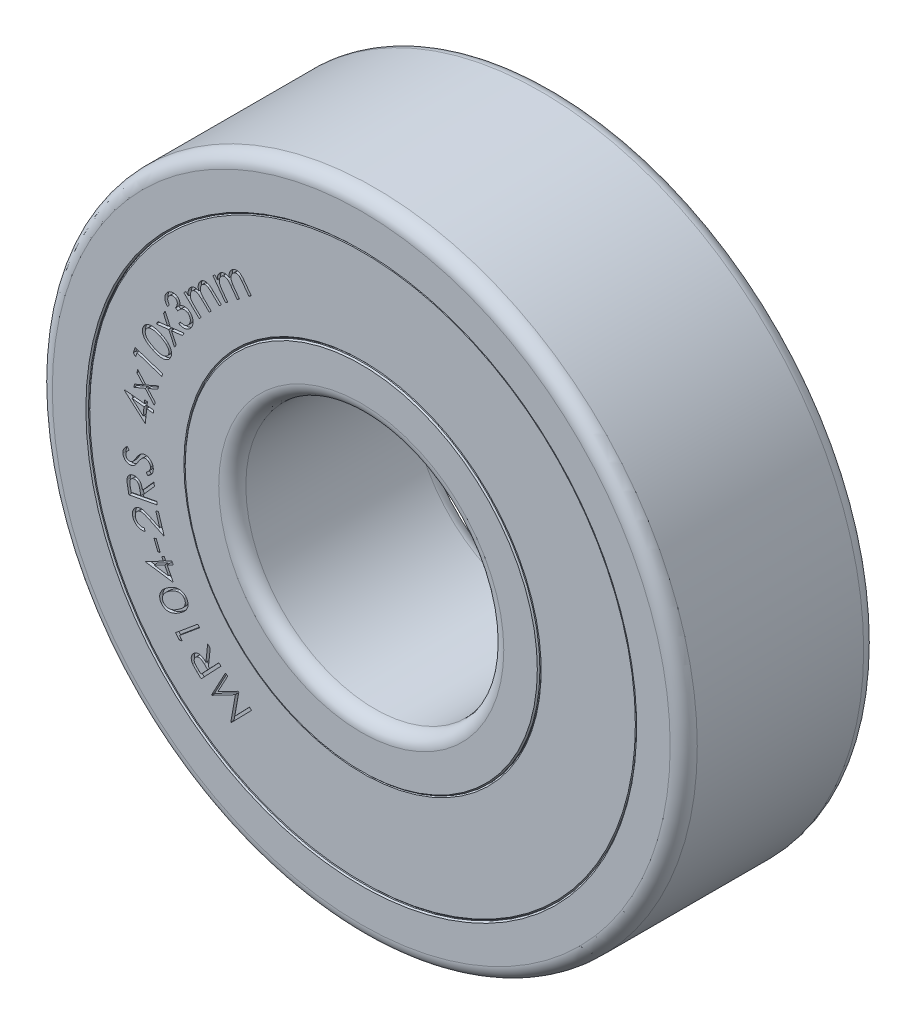
from build123d import *

# Parameters (mm, degrees)
SKETCH_R_INNER_BODY_W          = 3
SKETCH_R_INNER_BODY_H          = 0.75
FILLET_INNER_BODY_R            = 0.21
CHAMFER_INNER_BODY_SIZE        = 0.02
SKETCH_R_OUTER_BODY_W          = 3
SKETCH_R_OUTER_BODY_H          = 0.75
FILLET_OUTER_BODY_R            = 0.21
CHAMFER_OUTER_BODY_SIZE        = 0.02
SKETCH_R_SEAL_FACES_W          = 2.96
SKETCH_R_SEAL_FACES_H          = 1.5
CHAMFER_SEALS_SIZE             = 0.02
CUT_EXTRUDE_SEAL_LABEL_1_DEPTH = 0.05
CUT_EXTRUDE_SEAL_LABEL_2_DEPTH = 0.05


with BuildPart() as part:
    # Sketch R, INNER BODY → Revolve INNER BODY (revolve)
    with BuildSketch(Plane(origin=(0, 0, 0), x_dir=(0, 0, -1), z_dir=(1, 0, 0))):
        with Locations((0, 2.375)):
            Rectangle(SKETCH_R_INNER_BODY_W, SKETCH_R_INNER_BODY_H)
    revolve(axis=Axis((0, 0, 17.5), (0, 0, -1)))

    # Fillet INNER BODY
    fillet_inner_body_edges = [part.edges().sort_by_distance(p)[0] for p in [
        (0, -2, 1.5),
        (0, -2, -1.5),
    ]]
    fillet(fillet_inner_body_edges, radius=FILLET_INNER_BODY_R)

    # Chamfer INNER BODY
    chamfer_inner_body_edges = [part.edges().sort_by_distance(p)[0] for p in [
        (0, -2.75, -1.5),
        (0, -2.75, 1.5),
    ]]
    chamfer(chamfer_inner_body_edges, length=CHAMFER_INNER_BODY_SIZE)


with BuildPart() as body_2:
    # Sketch R, OUTER BODY → Revolve OUTER BODY (revolve)
    with BuildSketch(Plane(origin=(0, 0, 0), x_dir=(0, 0, -1), z_dir=(1, 0, 0))):
        with Locations((0, 4.625)):
            Rectangle(SKETCH_R_OUTER_BODY_W, SKETCH_R_OUTER_BODY_H)
    revolve(axis=Axis((0, 0, 17.5), (0, 0, -1)))

    # Fillet OUTER BODY
    fillet_outer_body_edges = [body_2.edges().sort_by_distance(p)[0] for p in [
        (0, -5, -1.5),
        (0, -5, 1.5),
    ]]
    fillet(fillet_outer_body_edges, radius=FILLET_OUTER_BODY_R)

    # Chamfer OUTER BODY
    chamfer_outer_body_edges = [body_2.edges().sort_by_distance(p)[0] for p in [
        (0, -4.25, 1.5),
        (0, -4.25, -1.5),
    ]]
    chamfer(chamfer_outer_body_edges, length=CHAMFER_OUTER_BODY_SIZE)


with BuildPart() as body_3:
    # Sketch R, SEAL FACES → Revolve SEALS (revolve)
    with BuildSketch(Plane(origin=(0, 0, 0), x_dir=(0, 0, -1), z_dir=(1, 0, 0))):
        with Locations((0, 3.5)):
            Rectangle(SKETCH_R_SEAL_FACES_W, SKETCH_R_SEAL_FACES_H)
    revolve(axis=Axis((0, 0, 17.5), (0, 0, -1)))

    # Chamfer SEALS
    chamfer_seals_edges = [body_3.edges().sort_by_distance(p)[0] for p in [
        (0, -2.75, -1.48),
        (0, -4.25, -1.48),
        (0, -4.25, 1.48),
        (0, -2.75, 1.48),
    ]]
    chamfer(chamfer_seals_edges, length=CHAMFER_SEALS_SIZE)

    # Sketch TEXT RADIUS 1 — MANUALLY ASSIGN TEXT AND FONT SIZE (FROM EQUATIONS) → Cut-Extrude SEAL LABEL 1 (cut)
    # profile 1 of 17: a face of its own
    with BuildSketch(Plane.XY.offset(1.48)):
        with BuildLine():
            Line((-2.320429497, 2.75401997), (-2.286354977, 2.779080066))
            Line((-2.286354977, 2.779080066), (-2.252550891, 2.733016364))
            add(Edge.make_bspline(
                [(-2.252550891, 2.733016364), (-2.252575927, 2.7391814), (-2.252624038, 2.751028417), (-2.250858899, 2.767976612), (-2.247977176, 2.783385136), (-2.244670843, 2.792783508), (-2.243085747, 2.797289201)],
                knots=[0, 0, 0, 0, 1.130972775, 2.173329348, 3.124271882, 4, 4, 4, 4], degree=3))
            add(Edge.make_bspline(
                [(-2.243085747, 2.797289201), (-2.240538606, 2.802874744), (-2.235525009, 2.813868903), (-2.225364339, 2.828701566), (-2.213803534, 2.842143996), (-2.204601468, 2.8494384), (-2.199996804, 2.85308848)],
                knots=[0, 0, 0, 0, 1.030792979, 2.02893478, 3.013689685, 4, 4, 4, 4], degree=3))
            add(Edge.make_bspline(
                [(-2.199996804, 2.85308848), (-2.196738298, 2.855357281), (-2.190278244, 2.859855223), (-2.179838965, 2.865230209), (-2.169000238, 2.869525013), (-2.157816431, 2.872646485), (-2.14655051, 2.874604258), (-2.135494737, 2.875485852), (-2.124788154, 2.875011096), (-2.114210936, 2.873381324), (-2.10348916, 2.870226727), (-2.092334897, 2.865396996), (-2.080516538, 2.859106109), (-2.072729161, 2.85391185), (-2.06865666, 2.851195451)],
                knots=[0, 0, 0, 0, 1.009076838, 2.000514788, 2.978455086, 3.970629344, 4.948270897, 5.883302657, 6.786036117, 7.668181397, 8.599456738, 9.620161656, 10.755435416, 12, 12, 12, 12], degree=3))
            add(Edge.make_bspline(
                [(-2.06865666, 2.851195451), (-2.069093705, 2.854797247), (-2.069954946, 2.861894954), (-2.070430343, 2.872492974), (-2.070522171, 2.882819695), (-2.069729912, 2.892869151), (-2.068513994, 2.902632233), (-2.066609627, 2.912120378), (-2.064086944, 2.92134048), (-2.059904576, 2.933147667), (-2.053301749, 2.947063226), (-2.043469506, 2.962393248), (-2.031442625, 2.975930517), (-2.0220765, 2.983443477), (-2.017364593, 2.987223095)],
                knots=[0, 0, 0, 0, 0.854015319, 1.682924531, 2.496595141, 3.284001277, 4.054537632, 4.812166925, 5.560555275, 6.303505611, 7.759387743, 9.17632314, 10.579465449, 12, 12, 12, 12], degree=3))
            add(Edge.make_bspline(
                [(-2.017364593, 2.987223095), (-2.012761324, 2.990370254), (-2.003733618, 2.996542309), (-1.988986692, 3.003222284), (-1.973787859, 3.007532007), (-1.958262295, 3.009509209), (-1.94265795, 3.009200683), (-1.927278852, 3.006320628), (-1.912290706, 3.001100767), (-1.900131292, 2.994859033), (-1.890528696, 2.988410284), (-1.882923661, 2.982557725), (-1.875244405, 2.975505193), (-1.867026931, 2.967722476), (-1.858860661, 2.958632784), (-1.850214458, 2.948745225), (-1.841520823, 2.93767733), (-1.835680164, 2.929931548), (-1.832659064, 2.925925018)],
                knots=[0, 0, 0, 0, 1.206586376, 2.36629839, 3.489703799, 4.618812718, 5.745609831, 6.85801607, 7.994722453, 9.174191865, 9.808089319, 10.499693112, 11.251345733, 12.066433185, 12.951235933, 13.89765161, 14.912553689, 16, 16, 16, 16], degree=3))
            Line((-1.832659064, 2.925925018), (-1.725748006, 2.780342086))
            Line((-1.725748006, 2.780342086), (-1.760814112, 2.75465098))
            Line((-1.760814112, 2.75465098), (-1.86772517, 2.900233912))
            add(Edge.make_bspline(
                [(-1.86772517, 2.900233912), (-1.870251892, 2.903680437), (-1.875092985, 2.910283832), (-1.882475821, 2.919431391), (-1.889182771, 2.92779071), (-1.895577346, 2.93510943), (-1.901603462, 2.941385337), (-1.907130563, 2.946776143), (-1.912192024, 2.951219248), (-1.918445616, 2.955658804), (-1.926263578, 2.959863211), (-1.936105276, 2.963359893), (-1.946495735, 2.965153375), (-1.957253792, 2.965302236), (-1.968175117, 2.963880287), (-1.979031568, 2.960665191), (-1.989689565, 2.955655456), (-1.996298885, 2.951141828), (-1.999696324, 2.948821653)],
                knots=[0, 0, 0, 0, 1.266208598, 2.426002646, 3.482927299, 4.442041616, 5.304848523, 6.060515602, 6.729826918, 7.298105317, 8.329977204, 9.349441828, 10.38004509, 11.439816583, 12.526625899, 13.631128664, 14.782311068, 16, 16, 16, 16], degree=3))
            add(Edge.make_bspline(
                [(-1.999696324, 2.948821653), (-2.003651147, 2.945633802), (-2.011494708, 2.93931137), (-2.021310081, 2.927780108), (-2.029120264, 2.914773629), (-2.035054428, 2.90059955), (-2.038803714, 2.885584023), (-2.040406602, 2.870182943), (-2.039503495, 2.854576548), (-2.036958755, 2.841403962), (-2.033496691, 2.830423064), (-2.029740145, 2.821314567), (-2.024940306, 2.81143647), (-2.019108959, 2.800744186), (-2.012258637, 2.789224789), (-2.004317447, 2.776921244), (-1.995349588, 2.763793026), (-1.988900789, 2.754875954), (-1.985543679, 2.750233912)],
                knots=[0, 0, 0, 0, 1.079163053, 2.140292941, 3.201808065, 4.296693207, 5.397778339, 6.483852516, 7.578775001, 8.712408282, 9.329208854, 10.026206568, 10.806954489, 11.665303622, 12.617160073, 13.658316574, 14.780968605, 16, 16, 16, 16], degree=3))
            Line((-1.985543679, 2.750233912), (-1.908830939, 2.645846893))
            Line((-1.908830939, 2.645846893), (-1.942905458, 2.620876941))
            Line((-1.942905458, 2.620876941), (-2.043145843, 2.757355307))
            add(Edge.make_bspline(
                [(-2.043145843, 2.757355307), (-2.046018562, 2.761210458), (-2.051502165, 2.768569378), (-2.059572988, 2.779008029), (-2.06708458, 2.788352559), (-2.074110112, 2.79656723), (-2.080603752, 2.803666626), (-2.086637645, 2.80957175), (-2.092032487, 2.814542926), (-2.098548741, 2.819531434), (-2.106692766, 2.824268263), (-2.116852193, 2.828342617), (-2.127602102, 2.830471953), (-2.138659614, 2.831013345), (-2.149867589, 2.829865597), (-2.160940872, 2.826813713), (-2.171764022, 2.821939495), (-2.178396254, 2.817379423), (-2.18178767, 2.815047614)],
                knots=[0, 0, 0, 0, 1.338684308, 2.555352919, 3.67387553, 4.676667863, 5.564808229, 6.351685695, 7.027066522, 7.606069248, 8.633514905, 9.640313198, 10.639609035, 11.669946275, 12.713112586, 13.762467864, 14.855829872, 16, 16, 16, 16], degree=3))
            add(Edge.make_bspline(
                [(-2.18178767, 2.815047614), (-2.185602646, 2.812017924), (-2.193184083, 2.805997073), (-2.202466831, 2.794705656), (-2.210283566, 2.782137399), (-2.216092574, 2.768147577), (-2.220142839, 2.75334121), (-2.221714378, 2.738008412), (-2.221169331, 2.722445116), (-2.218834065, 2.709295501), (-2.215623012, 2.698467874), (-2.212221131, 2.689739193), (-2.208072741, 2.680380559), (-2.202869248, 2.670497713), (-2.196879808, 2.659969891), (-2.189839336, 2.648984469), (-2.182120526, 2.637286543), (-2.176440371, 2.629449025), (-2.1734944, 2.625384153)],
                knots=[0, 0, 0, 0, 1.088561342, 2.163278841, 3.254230778, 4.39438673, 5.543823415, 6.681114648, 7.832835246, 9.022483321, 9.661402967, 10.360203033, 11.119501885, 11.953420926, 12.860942372, 13.832013831, 14.875589582, 16, 16, 16, 16], degree=3))
            Line((-2.1734944, 2.625384153), (-2.090471564, 2.512433432))
            Line((-2.090471564, 2.512433432), (-2.124546083, 2.487373336))
            Line((-2.124546083, 2.487373336), (-2.320429497, 2.75401997))
        make_face()
    # profile 2 of 17: a face of its own
    with BuildSketch(Plane.XY.offset(1.48)):
        with BuildLine():
            Line((-2.77050512, 2.300049392), (-2.741298389, 2.330608286))
            Line((-2.741298389, 2.330608286), (-2.700012331, 2.291125113))
            add(Edge.make_bspline(
                [(-2.700012331, 2.291125113), (-2.70107093, 2.297181705), (-2.703105718, 2.308823391), (-2.704484376, 2.325769102), (-2.704299862, 2.341420242), (-2.702681476, 2.351232991), (-2.70190536, 2.355938815)],
                knots=[0, 0, 0, 0, 1.130412312, 2.172823724, 3.123755117, 4, 4, 4, 4], degree=3))
            add(Edge.make_bspline(
                [(-2.70190536, 2.355938815), (-2.700360699, 2.361885551), (-2.697318512, 2.373597559), (-2.689898157, 2.389995597), (-2.680792291, 2.405227725), (-2.672995488, 2.414011911), (-2.66909286, 2.418408767)],
                knots=[0, 0, 0, 0, 1.030778021, 2.03010208, 3.013983045, 4, 4, 4, 4], degree=3))
            add(Edge.make_bspline(
                [(-2.66909286, 2.418408767), (-2.666297542, 2.421180285), (-2.660729442, 2.426700979), (-2.65136422, 2.43374856), (-2.641504716, 2.440004481), (-2.630985654, 2.444950909), (-2.620261237, 2.448926128), (-2.609510549, 2.451693645), (-2.598851589, 2.453017431), (-2.588174024, 2.453255577), (-2.57708683, 2.452018108), (-2.565322009, 2.449214676), (-2.552652688, 2.444949501), (-2.544122339, 2.441140726), (-2.539645745, 2.43914194)],
                knots=[0, 0, 0, 0, 1.001343193, 1.994613865, 2.97766345, 3.970197001, 4.948200756, 5.887263398, 6.789859928, 7.677608924, 8.601205962, 9.622092932, 10.752111387, 12, 12, 12, 12], degree=3))
            add(Edge.make_bspline(
                [(-2.539645745, 2.43914194), (-2.540664857, 2.442649914), (-2.542666102, 2.449538573), (-2.545156678, 2.459864823), (-2.546878873, 2.470045357), (-2.547827487, 2.480079683), (-2.548315145, 2.489917584), (-2.548157981, 2.499619434), (-2.547241362, 2.509136661), (-2.545208292, 2.521479445), (-2.54118546, 2.536322957), (-2.53399316, 2.553013242), (-2.524703285, 2.568570214), (-2.516721106, 2.577569092), (-2.51269262, 2.58211069)],
                knots=[0, 0, 0, 0, 0.859676095, 1.688158322, 2.498483592, 3.287293065, 4.058924584, 4.815734214, 5.568668265, 6.306913106, 7.75825991, 9.174324163, 10.573923749, 12, 12, 12, 12], degree=3))
            add(Edge.make_bspline(
                [(-2.51269262, 2.58211069), (-2.508710548, 2.585988743), (-2.500901368, 2.593593933), (-2.4875687, 2.602759638), (-2.473384829, 2.609708098), (-2.458411136, 2.614298785), (-2.443012793, 2.616682427), (-2.427369346, 2.616593853), (-2.411715892, 2.613960069), (-2.398673359, 2.60992706), (-2.388103436, 2.605248629), (-2.379612913, 2.600840806), (-2.370761131, 2.595328778), (-2.361405576, 2.589004047), (-2.351778833, 2.581480206), (-2.341566622, 2.5732526), (-2.331048713, 2.563916347), (-2.323975668, 2.557307026), (-2.320324831, 2.553895546)],
                knots=[0, 0, 0, 0, 1.204043879, 2.361231755, 3.492332374, 4.618048651, 5.745480917, 6.860121818, 7.99602034, 9.177336302, 9.810714976, 10.501680899, 11.250685002, 12.071493704, 12.950202052, 13.900012886, 14.916066682, 16, 16, 16, 16], degree=3))
            Line((-2.320324831, 2.553895546), (-2.189795985, 2.429135931))
            Line((-2.189795985, 2.429135931), (-2.219904158, 2.397675594))
            Line((-2.219904158, 2.397675594), (-2.350433004, 2.522435209))
            add(Edge.make_bspline(
                [(-2.350433004, 2.522435209), (-2.353511987, 2.525367132), (-2.359426538, 2.530999188), (-2.36817248, 2.538811384), (-2.376279033, 2.545801378), (-2.383836295, 2.551833006), (-2.390812963, 2.557002288), (-2.397138133, 2.561358617), (-2.402970758, 2.564732429), (-2.409844082, 2.568094531), (-2.418295803, 2.570904892), (-2.428604474, 2.572684036), (-2.439169019, 2.572626192), (-2.449799632, 2.570996671), (-2.460322987, 2.567767224), (-2.470418372, 2.562697265), (-2.480095213, 2.556002747), (-2.485789217, 2.550382469), (-2.488714254, 2.547495306)],
                knots=[0, 0, 0, 0, 1.261363842, 2.4230085, 3.478958593, 4.436873658, 5.290964494, 6.055021804, 6.714082053, 7.288263835, 8.322923958, 9.344480474, 10.378641161, 11.442801302, 12.525619353, 13.630022491, 14.782531287, 16, 16, 16, 16], degree=3))
            add(Edge.make_bspline(
                [(-2.488714254, 2.547495306), (-2.492058509, 2.543655994), (-2.498664769, 2.536071798), (-2.506299442, 2.523005298), (-2.511860547, 2.50890486), (-2.515143051, 2.493870212), (-2.516226502, 2.478441777), (-2.515035727, 2.462981521), (-2.51157431, 2.447731265), (-2.506737924, 2.435190563), (-2.501315032, 2.425036934), (-2.49608554, 2.416688104), (-2.489649636, 2.407765196), (-2.481990739, 2.398295843), (-2.473291455, 2.388120324), (-2.463315058, 2.377408181), (-2.452231333, 2.366039199), (-2.444323312, 2.358382504), (-2.440216658, 2.354406363)],
                knots=[0, 0, 0, 0, 1.081556253, 2.136512003, 3.201611978, 4.295347963, 5.397833827, 6.481655912, 7.583028641, 8.714667868, 9.329647949, 10.030483174, 10.809481272, 11.669289123, 12.621539982, 13.657745291, 14.783661448, 16, 16, 16, 16], degree=3))
            Line((-2.440216658, 2.354406363), (-2.346646947, 2.264983286))
            Line((-2.346646947, 2.264983286), (-2.375853677, 2.234424392))
            Line((-2.375853677, 2.234424392), (-2.498269543, 2.351431604))
            add(Edge.make_bspline(
                [(-2.498269543, 2.351431604), (-2.501744818, 2.354717773), (-2.508404106, 2.361014698), (-2.518136888, 2.369890676), (-2.52722918, 2.377682721), (-2.53552956, 2.384603216), (-2.543142688, 2.390475466), (-2.55013294, 2.395257171), (-2.556314365, 2.399188307), (-2.563596479, 2.403044289), (-2.572432295, 2.4063004), (-2.583176283, 2.408430687), (-2.594101678, 2.408766897), (-2.605120571, 2.407425421), (-2.615939621, 2.404275506), (-2.626250603, 2.399294773), (-2.636066228, 2.392668104), (-2.641802375, 2.387046542), (-2.644753918, 2.384153959)],
                knots=[0, 0, 0, 0, 1.332492114, 2.553308578, 3.669222679, 4.668168758, 5.5639249, 6.346440622, 7.027034098, 7.603674622, 8.639302467, 9.637476589, 10.642576972, 11.671552183, 12.717950578, 13.766356133, 14.85067533, 16, 16, 16, 16], degree=3))
            add(Edge.make_bspline(
                [(-2.644753918, 2.384153959), (-2.647946065, 2.380492584), (-2.654304255, 2.373199777), (-2.661597102, 2.36052367), (-2.667092548, 2.346756846), (-2.670450662, 2.331975091), (-2.671694207, 2.316681378), (-2.670848329, 2.301300313), (-2.667508085, 2.286094319), (-2.662860333, 2.273626134), (-2.65791287, 2.26349369), (-2.652965659, 2.2555242), (-2.647169531, 2.247093994), (-2.640376461, 2.238267946), (-2.632603879, 2.228988783), (-2.623865413, 2.219267444), (-2.614123504, 2.209165167), (-2.607156303, 2.202460447), (-2.603558004, 2.198997709)],
                knots=[0, 0, 0, 0, 1.086382156, 2.163879657, 3.257997424, 4.3981426, 5.546747132, 6.68673322, 7.83709311, 9.021650598, 9.660075137, 10.361059643, 11.12125253, 11.952230623, 12.855776992, 13.833277665, 14.880968964, 16, 16, 16, 16], degree=3))
            Line((-2.603558004, 2.198997709), (-2.502235889, 2.102182806))
            Line((-2.502235889, 2.102182806), (-2.53144262, 2.071623911))
            Line((-2.53144262, 2.071623911), (-2.77050512, 2.300049392))
        make_face()
    # profile 3 of 17: a face of its own
    with BuildSketch(Plane.XY.offset(1.48)):
        with BuildLine():
            Line((-2.996759698, 2.022530246), (-3.023081813, 1.985390823))
            add(Edge.make_bspline(
                [(-3.023081813, 1.985390823), (-3.02610934, 1.988894168), (-3.032034308, 1.99575033), (-3.039859214, 2.006552708), (-3.046797957, 2.017366026), (-3.052536821, 2.028366077), (-3.057326556, 2.03945875), (-3.060903508, 2.050700434), (-3.063447056, 2.062075131), (-3.065001567, 2.073504491), (-3.065436179, 2.084913606), (-3.064875379, 2.096126979), (-3.06347186, 2.107154717), (-3.060917323, 2.117950204), (-3.05740638, 2.128550113), (-3.05281581, 2.138847793), (-3.047453528, 2.149052813), (-3.043069585, 2.15547322), (-3.040840227, 2.158738179)],
                knots=[0, 0, 0, 0, 1.171211251, 2.292098653, 3.372163073, 4.419726262, 5.428143715, 6.426100511, 7.400132416, 8.374431402, 9.340865322, 10.284842783, 11.212914492, 12.149883493, 13.08765435, 14.034200795, 15.000335537, 16, 16, 16, 16], degree=3))
            add(Edge.make_bspline(
                [(-3.040840227, 2.158738179), (-3.037377001, 2.16331132), (-3.030510356, 2.172378632), (-3.018294829, 2.184209496), (-3.004818195, 2.194379961), (-2.990283421, 2.202920967), (-2.975008597, 2.209569426), (-2.95937247, 2.214070897), (-2.943617334, 2.216256251), (-2.927946591, 2.21621535), (-2.912667269, 2.214276993), (-2.898138852, 2.210385908), (-2.884474736, 2.204636762), (-2.876284925, 2.199282296), (-2.872180371, 2.196598756)],
                knots=[0, 0, 0, 0, 1.075562812, 2.132552134, 3.179424902, 4.238699285, 5.289651552, 6.298405097, 7.283543868, 8.26497797, 9.231846343, 10.166337423, 11.081008612, 12, 12, 12, 12], degree=3))
            add(Edge.make_bspline(
                [(-2.872180371, 2.196598756), (-2.868455476, 2.193756366), (-2.861125608, 2.188163097), (-2.851775671, 2.178090057), (-2.844079146, 2.167025277), (-2.837916923, 2.154983685), (-2.833608013, 2.141837683), (-2.830952623, 2.127691305), (-2.829811741, 2.112529809), (-2.830466596, 2.102156466), (-2.830804169, 2.096809092)],
                knots=[0, 0, 0, 0, 0.989140412, 1.946435558, 2.890999585, 3.831367431, 4.795613971, 5.804767192, 6.868375302, 8, 8, 8, 8], degree=3))
            add(Edge.make_bspline(
                [(-2.830804169, 2.096809092), (-2.825908892, 2.099694523), (-2.816273603, 2.105373866), (-2.800893948, 2.111715008), (-2.785091969, 2.11596991), (-2.774337148, 2.117138737), (-2.768965227, 2.117722554)],
                knots=[0, 0, 0, 0, 1.033132518, 2.033497082, 3.017752294, 4, 4, 4, 4], degree=3))
            add(Edge.make_bspline(
                [(-2.768965227, 2.117722554), (-2.765179755, 2.117907828), (-2.757726404, 2.118272622), (-2.746657414, 2.117690814), (-2.735918239, 2.116272606), (-2.72548194, 2.113908818), (-2.715345383, 2.110652025), (-2.705510881, 2.106494759), (-2.69598024, 2.101461866), (-2.690023185, 2.097407796), (-2.687024121, 2.095366785)],
                knots=[0, 0, 0, 0, 1.048574814, 2.064576797, 3.063305641, 4.043998845, 5.022537957, 6.006611657, 6.996433664, 8, 8, 8, 8], degree=3))
            add(Edge.make_bspline(
                [(-2.687024121, 2.095366785), (-2.682030534, 2.091541607), (-2.672082564, 2.083921284), (-2.659351919, 2.069908775), (-2.648229884, 2.05434513), (-2.639273492, 2.037096867), (-2.632266294, 2.018895199), (-2.627898662, 2.000025507), (-2.626249191, 1.980750556), (-2.627404364, 1.961322682), (-2.630978744, 1.941975681), (-2.637231973, 1.923070119), (-2.645863305, 1.904596553), (-2.653486533, 1.893143416), (-2.657366669, 1.8873139)],
                knots=[0, 0, 0, 0, 0.96570999, 1.923838005, 2.898353776, 3.900922391, 4.904268219, 5.890763602, 6.86940163, 7.869143774, 8.875231657, 9.886527968, 10.924266701, 12, 12, 12, 12], degree=3))
            add(Edge.make_bspline(
                [(-2.657366669, 1.8873139), (-2.660198137, 1.88354526), (-2.665766103, 1.876134383), (-2.674873172, 1.865950516), (-2.684476876, 1.85681274), (-2.694719364, 1.84891642), (-2.705331824, 1.841904555), (-2.716521156, 1.836106107), (-2.728202568, 1.831398478), (-2.740364537, 1.827798078), (-2.75291805, 1.825342846), (-2.765813752, 1.824177723), (-2.779006735, 1.824273871), (-2.792509312, 1.825689773), (-2.806327449, 1.828196246), (-2.820444875, 1.832056464), (-2.834894897, 1.837072528), (-2.844415389, 1.841327834), (-2.849283736, 1.843503804)],
                knots=[0, 0, 0, 0, 1.04513999, 2.055225259, 3.026436943, 3.980972543, 4.920026639, 5.844109072, 6.771071021, 7.709462679, 8.65316436, 9.603502743, 10.5765649, 11.574617543, 12.611244272, 13.68795191, 14.817723625, 16, 16, 16, 16], degree=3))
            Line((-2.849283736, 1.843503804), (-2.823953208, 1.879200919))
            add(Edge.make_bspline(
                [(-2.823953208, 1.879200919), (-2.820510841, 1.877958939), (-2.813829608, 1.8755484), (-2.80388013, 1.872696329), (-2.7944197, 1.87039206), (-2.785355805, 1.868827435), (-2.776734265, 1.868033686), (-2.768539789, 1.867813035), (-2.76076806, 1.868294812), (-2.755796765, 1.869263136), (-2.753370275, 1.869735775)],
                knots=[0, 0, 0, 0, 1.216756656, 2.361582674, 3.440204843, 4.45386637, 5.417424223, 6.317037996, 7.178545829, 8, 8, 8, 8], degree=3))
            add(Edge.make_bspline(
                [(-2.753370275, 1.869735775), (-2.750406083, 1.870516167), (-2.744503925, 1.872070045), (-2.735984403, 1.875493918), (-2.727774384, 1.87959834), (-2.719943345, 1.884642842), (-2.712468633, 1.890476087), (-2.705426145, 1.897248386), (-2.698617233, 1.904704482), (-2.694520277, 1.910203246), (-2.692432775, 1.913005006)],
                knots=[0, 0, 0, 0, 0.961515191, 1.914523494, 2.876455116, 3.839496339, 4.834043486, 5.848349725, 6.903679654, 8, 8, 8, 8], degree=3))
            add(Edge.make_bspline(
                [(-2.692432775, 1.913005006), (-2.690208024, 1.916272573), (-2.685848045, 1.922676225), (-2.68047922, 1.932724227), (-2.676039848, 1.942756231), (-2.672962057, 1.952886848), (-2.670657996, 1.962997683), (-2.669763452, 1.973199465), (-2.66967379, 1.983441731), (-2.670929329, 1.99360835), (-2.672980348, 2.003488022), (-2.675733335, 2.012974161), (-2.679468675, 2.021791477), (-2.683891529, 2.030092455), (-2.689172025, 2.037755511), (-2.695117429, 2.044968327), (-2.702020814, 2.051459926), (-2.707090082, 2.055297568), (-2.709650323, 2.057235775)],
                knots=[0, 0, 0, 0, 1.169524398, 2.291988159, 3.367796965, 4.411647595, 5.421903755, 6.431885714, 7.437116084, 8.448976789, 9.457390452, 10.422784229, 11.367797569, 12.287216506, 13.202624354, 14.118377933, 15.049684005, 16, 16, 16, 16], degree=3))
            add(Edge.make_bspline(
                [(-2.709650323, 2.057235775), (-2.713247136, 2.059615233), (-2.720412327, 2.064355338), (-2.732392539, 2.06921774), (-2.74498769, 2.072564776), (-2.758144474, 2.073926095), (-2.771426545, 2.073603073), (-2.784474472, 2.071407683), (-2.797117551, 2.067421709), (-2.807256336, 2.062486291), (-2.815301998, 2.05743132), (-2.821657559, 2.052760853), (-2.828240665, 2.047176286), (-2.835203595, 2.040910712), (-2.84231655, 2.033642046), (-2.849671766, 2.0254932), (-2.857442258, 2.016629601), (-2.862528913, 2.010290697), (-2.865149121, 2.007025438)],
                knots=[0, 0, 0, 0, 1.126265953, 2.243627825, 3.365243803, 4.528146704, 5.69251129, 6.832857479, 7.979477972, 9.150754052, 9.772643127, 10.46475998, 11.212917426, 12.03131228, 12.915530437, 13.873058291, 14.904382136, 16, 16, 16, 16], degree=3))
            Line((-2.865149121, 2.007025438), (-2.898592631, 2.030733371))
            add(Edge.make_bspline(
                [(-2.898592631, 2.030733371), (-2.895767972, 2.034884981), (-2.890219537, 2.043039924), (-2.883576969, 2.05600975), (-2.87834813, 2.069157445), (-2.874795543, 2.08239017), (-2.872732708, 2.095201119), (-2.872043335, 2.107256837), (-2.873204417, 2.118329602), (-2.875933167, 2.128421925), (-2.880064946, 2.137479704), (-2.885196252, 2.145736128), (-2.891684638, 2.152944062), (-2.896757168, 2.156916374), (-2.899313784, 2.158918467)],
                knots=[0, 0, 0, 0, 1.266479845, 2.487726794, 3.669447331, 4.83227404, 5.938329243, 6.940556544, 7.87114067, 8.735940878, 9.567679085, 10.375700568, 11.181333401, 12, 12, 12, 12], degree=3))
            add(Edge.make_bspline(
                [(-2.899313784, 2.158918467), (-2.90129986, 2.160254809), (-2.905238354, 2.162904846), (-2.911562092, 2.166064246), (-2.918122246, 2.168376236), (-2.924829942, 2.170174851), (-2.931829679, 2.171018826), (-2.939050674, 2.171240171), (-2.946466205, 2.170526648), (-2.954013924, 2.169303313), (-2.961514265, 2.167353835), (-2.968790157, 2.164623132), (-2.975714127, 2.161178556), (-2.98238805, 2.157130661), (-2.988584138, 2.152186652), (-2.994539703, 2.146666684), (-3.000313795, 2.140540558), (-3.003688093, 2.135940291), (-3.005413544, 2.133587938)],
                knots=[0, 0, 0, 0, 0.945616017, 1.875206671, 2.784465465, 3.691938124, 4.614215051, 5.564741846, 6.542269923, 7.553773912, 8.585167377, 9.600013349, 10.619920928, 11.638513524, 12.679234894, 13.746724718, 14.847785029, 16, 16, 16, 16], degree=3))
            add(Edge.make_bspline(
                [(-3.005413544, 2.133587938), (-3.007993936, 2.129671082), (-3.013005194, 2.122064339), (-3.017973045, 2.109463264), (-3.020967033, 2.096613444), (-3.021402373, 2.085549439), (-3.020548414, 2.076607973), (-3.019294605, 2.069561289), (-3.01717251, 2.062321093), (-3.014438098, 2.054805644), (-3.011125387, 2.047040366), (-3.006982736, 2.039075092), (-3.002262525, 2.030793136), (-2.998626649, 2.025333607), (-2.996759698, 2.022530246)],
                knots=[0, 0, 0, 0, 1.405190645, 2.728954754, 4.042437465, 5.351977778, 6.03168838, 6.737896041, 7.497701651, 8.294081441, 9.13888423, 10.030760139, 10.988834309, 12, 12, 12, 12], degree=3))
        make_face()
    # profile 4 of 17: a face of its own
    with BuildSketch(Plane.XY.offset(1.48)):
        Polygon((-3.196828585, 1.665890156), (-3.171858634, 1.710421406), (-3.022309355, 1.726737511), (-3.086221614, 1.862945444), (-3.061341807, 1.90738655), (-2.979671134, 1.731965877), (-2.766209595, 1.758107704), (-2.79144998, 1.713125733), (-2.96191272, 1.692843281), (-2.889707191, 1.538065636), (-2.914586999, 1.493804819), (-3.004460797, 1.687795204), align=None)
    # profile 5 of 17: a face of its own
    with BuildSketch(Plane.XY.offset(1.48)):
        with BuildLine():
            add(Edge.make_bspline(
                [(-3.249582214, 1.290846164), (-3.256056691, 1.293881461), (-3.268627117, 1.299774599), (-3.286688716, 1.308838418), (-3.3033243, 1.318033704), (-3.31852203, 1.327341671), (-3.332484978, 1.33646324), (-3.344937727, 1.34578425), (-3.356072097, 1.35505137), (-3.3658979, 1.364381807), (-3.374522123, 1.373877073), (-3.382279139, 1.383401245), (-3.389188395, 1.393071359), (-3.395145936, 1.4029452), (-3.40030131, 1.412929501), (-3.404566092, 1.423053322), (-3.407902739, 1.433312612), (-3.410472664, 1.443669849), (-3.4120065, 1.454088568), (-3.413012466, 1.464442507), (-3.412931866, 1.474693232), (-3.41227155, 1.484887695), (-3.410632368, 1.494959477), (-3.408122826, 1.504932614), (-3.405075884, 1.514881256), (-3.402261105, 1.52127939), (-3.400844234, 1.524500011)],
                knots=[0, 0, 0, 0, 1.644145222, 3.192166452, 4.645704596, 6.0131107, 7.289329799, 8.479077973, 9.587507604, 10.618629684, 11.591830595, 12.534914789, 13.441691471, 14.322078477, 15.184193145, 16.023384304, 16.844897827, 17.662654875, 18.473700596, 19.26436113, 20.05199717, 20.827786547, 21.611534202, 22.394093275, 23.191636696, 24, 24, 24, 24], degree=3))
            add(Edge.make_bspline(
                [(-3.400844234, 1.524500011), (-3.399297988, 1.527709162), (-3.396218988, 1.534099467), (-3.39081368, 1.543189465), (-3.384732878, 1.551703928), (-3.378080734, 1.559643426), (-3.370779718, 1.56695257), (-3.363058849, 1.573899705), (-3.354526864, 1.580050166), (-3.34550809, 1.585793013), (-3.335876052, 1.590796125), (-3.325747372, 1.595180431), (-3.315050695, 1.598665533), (-3.303844784, 1.601467135), (-3.292124348, 1.603512344), (-3.279903845, 1.604894588), (-3.26716431, 1.605383609), (-3.253863545, 1.605205301), (-3.239913239, 1.604244117), (-3.225307196, 1.602144653), (-3.210026446, 1.598882594), (-3.193991633, 1.59488878), (-3.177279758, 1.589690611), (-3.159893841, 1.583428818), (-3.141756806, 1.576229134), (-3.129552069, 1.570816665), (-3.123290147, 1.568039674)],
                knots=[0, 0, 0, 0, 0.813218948, 1.61934303, 2.411443419, 3.20041679, 3.981623334, 4.769163075, 5.5693071, 6.380322827, 7.209027589, 8.045170663, 8.897957668, 9.775024671, 10.680930079, 11.612992081, 12.581400551, 13.590198392, 14.649628755, 15.772409967, 16.956685372, 18.216537437, 19.544884757, 20.95133042, 22.43580985, 24, 24, 24, 24], degree=3))
            add(Edge.make_bspline(
                [(-3.123290147, 1.568039674), (-3.117111272, 1.565165133), (-3.105046942, 1.559552556), (-3.08774805, 1.550686925), (-3.071793773, 1.541462842), (-3.056834807, 1.532517296), (-3.043360969, 1.52303624), (-3.030924904, 1.513725063), (-3.019789206, 1.504169604), (-3.009948702, 1.49434939), (-3.001062269, 1.484538158), (-2.99321205, 1.474551313), (-2.986121657, 1.464550278), (-2.979970731, 1.45438229), (-2.974845825, 1.444035985), (-2.970449406, 1.433647044), (-2.967038173, 1.423086467), (-2.964487111, 1.412446898), (-2.962927841, 1.401792864), (-2.961944472, 1.391227701), (-2.961986449, 1.380733806), (-2.962775562, 1.370363903), (-2.964436623, 1.360091768), (-2.966827856, 1.349912379), (-2.970209554, 1.339872784), (-2.972977222, 1.333347208), (-2.974371878, 1.330058905)],
                knots=[0, 0, 0, 0, 1.557030064, 3.040119984, 4.439233055, 5.767418004, 7.020554201, 8.20143928, 9.316210469, 10.369678099, 11.37600603, 12.338865682, 13.270273243, 14.175712034, 15.05075969, 15.906306139, 16.750873637, 17.583497126, 18.402996831, 19.209188366, 20.005585773, 20.797531843, 21.583113676, 22.380753006, 23.184045247, 24, 24, 24, 24], degree=3))
            add(Edge.make_bspline(
                [(-2.974371878, 1.330058905), (-2.97591903, 1.32687992), (-2.978982153, 1.320586018), (-2.984319078, 1.31166518), (-2.990206285, 1.303302345), (-2.996718267, 1.295521328), (-3.003862167, 1.288318454), (-3.011553418, 1.281600582), (-3.019843245, 1.275480494), (-3.028707347, 1.269968111), (-3.038076744, 1.265110982), (-3.047938754, 1.260904458), (-3.058380195, 1.257632743), (-3.069259849, 1.254877538), (-3.080663684, 1.253031989), (-3.092525198, 1.251852256), (-3.104868245, 1.251429611), (-3.117783906, 1.251680445), (-3.131373587, 1.252854651), (-3.14576019, 1.255159963), (-3.160970374, 1.258538525), (-3.177067704, 1.262882981), (-3.194023167, 1.268321974), (-3.211829794, 1.274847419), (-3.230526725, 1.282299863), (-3.243112041, 1.287944321), (-3.249582214, 1.290846164)],
                knots=[0, 0, 0, 0, 0.813966125, 1.611527629, 2.391081521, 3.167279961, 3.945358007, 4.725280424, 5.516995817, 6.315847315, 7.126807146, 7.945554533, 8.78158021, 9.644304301, 10.528304988, 11.439332992, 12.388061731, 13.37098064, 14.412934833, 15.526800008, 16.72405265, 17.999889818, 19.365581687, 20.823607572, 22.36700085, 24, 24, 24, 24], degree=3))
        make_face()
        with BuildLine():
            add(Edge.make_bspline(
                [(-3.231282936, 1.32888703), (-3.225704206, 1.326399823), (-3.214896238, 1.321581226), (-3.199022647, 1.314959373), (-3.184012904, 1.309297169), (-3.16988482, 1.304478347), (-3.156628237, 1.300492393), (-3.144246463, 1.297319927), (-3.132728095, 1.29499743), (-3.121998703, 1.293648297), (-3.111881714, 1.2929948), (-3.102218843, 1.293013414), (-3.09288185, 1.29352321), (-3.083927124, 1.294668571), (-3.075338491, 1.296493875), (-3.067153915, 1.298940948), (-3.059260912, 1.301892679), (-3.049447138, 1.306659798), (-3.038251594, 1.313710026), (-3.026720166, 1.323784651), (-3.0170819, 1.335156869), (-3.012645432, 1.343840649), (-3.01042957, 1.348177895)],
                knots=[0, 0, 0, 0, 1.478609089, 2.864587404, 4.162909562, 5.361354645, 6.477504642, 7.513098286, 8.454624618, 9.319863621, 10.128881398, 10.907199252, 11.657691218, 12.391211858, 13.090273024, 13.780728393, 14.457562141, 15.127757602, 16.419276492, 17.646191136, 18.824354387, 20, 20, 20, 20], degree=3))
            add(Edge.make_bspline(
                [(-3.01042957, 1.348177895), (-3.008606488, 1.35272326), (-3.004962048, 1.36180969), (-3.002548086, 1.376448803), (-3.002485226, 1.391558585), (-3.004414429, 1.404375536), (-3.007287588, 1.414673793), (-3.010046073, 1.42249637), (-3.013728726, 1.430126428), (-3.017940929, 1.437774112), (-3.023019876, 1.445199103), (-3.028758951, 1.452583388), (-3.035204211, 1.459841506), (-3.039937817, 1.464462204), (-3.042340628, 1.466807703)],
                knots=[0, 0, 0, 0, 1.337532369, 2.673799166, 4.031220837, 5.462279115, 6.204731151, 6.956783478, 7.729606792, 8.521461622, 9.345154003, 10.189337861, 11.080895384, 12, 12, 12, 12], degree=3))
            add(Edge.make_bspline(
                [(-3.042340628, 1.466807703), (-3.045462624, 1.469729514), (-3.051813078, 1.475672773), (-3.062134371, 1.484041219), (-3.073284186, 1.492105772), (-3.085015048, 1.500177319), (-3.097668342, 1.507802979), (-3.110966076, 1.515408602), (-3.125112995, 1.522693523), (-3.134902362, 1.527238582), (-3.139876686, 1.529548087)],
                knots=[0, 0, 0, 0, 0.880624901, 1.791279686, 2.734667443, 3.714960803, 4.723457601, 5.776811381, 6.870319125, 8, 8, 8, 8], degree=3))
            add(Edge.make_bspline(
                [(-3.139876686, 1.529548087), (-3.144884174, 1.531766015), (-3.154697775, 1.536112677), (-3.169252501, 1.542068303), (-3.183316834, 1.547237656), (-3.196904865, 1.551541312), (-3.209923835, 1.555297167), (-3.222508454, 1.558181402), (-3.234570358, 1.560354145), (-3.24612442, 1.561836954), (-3.25717373, 1.562506161), (-3.26773776, 1.562779333), (-3.277790845, 1.562187238), (-3.287344407, 1.561148103), (-3.296387067, 1.559431486), (-3.304956182, 1.557105809), (-3.313023216, 1.554140379), (-3.322846263, 1.549355639), (-3.333949944, 1.54237245), (-3.34550067, 1.532491218), (-3.35491439, 1.521109194), (-3.359399225, 1.512539501), (-3.361631493, 1.508274049)],
                knots=[0, 0, 0, 0, 1.326635902, 2.599921184, 3.808852145, 4.95522493, 6.052044833, 7.0902755, 8.081167111, 9.020115383, 9.910046824, 10.761801075, 11.578205456, 12.347463686, 13.088374345, 13.805298574, 14.496217997, 15.166863895, 16.449208869, 17.66190298, 18.836242692, 20, 20, 20, 20], degree=3))
            add(Edge.make_bspline(
                [(-3.361631493, 1.508274049), (-3.363466368, 1.503730417), (-3.367143599, 1.494624626), (-3.369384489, 1.479872661), (-3.369527972, 1.464584702), (-3.367440442, 1.45161025), (-3.364630881, 1.441123238), (-3.361687276, 1.433285486), (-3.358227118, 1.425477092), (-3.353813678, 1.41792203), (-3.348849263, 1.410427462), (-3.343247844, 1.402969992), (-3.336834337, 1.395735188), (-3.329725523, 1.388483629), (-3.321583991, 1.381337828), (-3.312407585, 1.374004046), (-3.301882575, 1.366733617), (-3.290124673, 1.359355021), (-3.277164672, 1.351813486), (-3.263003678, 1.344121064), (-3.247552992, 1.336514725), (-3.236820288, 1.33148304), (-3.231282936, 1.32888703)],
                knots=[0, 0, 0, 0, 1.182323849, 2.369468429, 3.58391738, 4.871578208, 5.5348884, 6.20899319, 6.895688989, 7.599235691, 8.323303874, 9.070873091, 9.854161027, 10.661486156, 11.526886976, 12.474065711, 13.502921491, 14.620638151, 15.832951557, 17.131246278, 18.519916334, 20, 20, 20, 20], degree=3))
        make_face(mode=Mode.SUBTRACT)
    # profile 6 of 17: a face of its own
    with BuildSketch(Plane.XY.offset(1.48)):
        Polygon((-3.552670237, 1.103060067), (-3.524995958, 1.186894202), (-3.098163025, 1.045728336), (-3.112135381, 1.003360548), (-3.497141391, 1.130734346), (-3.519316872, 1.063757182), align=None)
    # profile 7 of 17: a face of its own
    with BuildSketch(Plane.XY.offset(1.48)):
        Polygon((-3.546681418, 0.63986235), (-3.535683822, 0.689531821), (-3.39758286, 0.748305859), (-3.497823245, 0.859904417), (-3.486825649, 0.909664032), (-3.35837012, 0.765703696), (-3.161945841, 0.852152013), (-3.173123725, 0.801851532), (-3.330154975, 0.733341917), (-3.2164831, 0.606328696), (-3.227390552, 0.556929657), (-3.369277572, 0.716304657), align=None)
    # profile 8 of 17: a face of its own
    with BuildSketch(Plane.XY.offset(1.48)):
        Polygon((-3.693803561, 0.528215933), (-3.692811974, 0.537230356), (-3.383887695, 0.503606558), (-3.378118465, 0.557242375), (-3.335660532, 0.55264502), (-3.341429763, 0.499009202), (-3.238304763, 0.487831318), (-3.243172551, 0.4435705), (-3.346297551, 0.454748385), (-3.36928433, 0.242819299), align=None)
        Polygon((-3.388755484, 0.459345741), (-3.573551157, 0.479447904), (-3.402908128, 0.328816895), align=None, mode=Mode.SUBTRACT)
    # profile 9 of 17: a face of its own
    with BuildSketch(Plane.XY.offset(1.48)):
        with BuildLine():
            Line((-3.329386338, -0.437456126), (-3.3549873, -0.401037856))
            add(Edge.make_bspline(
                [(-3.3549873, -0.401037856), (-3.349391427, -0.397284179), (-3.338687408, -0.390103989), (-3.324378975, -0.378340486), (-3.312321774, -0.366438227), (-3.302610428, -0.354218245), (-3.295329207, -0.341688122), (-3.290190143, -0.329008057), (-3.287516125, -0.31596349), (-3.287725207, -0.307237829), (-3.287829848, -0.302870789)],
                knots=[0, 0, 0, 0, 1.293927635, 2.47507894, 3.55271993, 4.543572214, 5.464398836, 6.327347718, 7.162866959, 8, 8, 8, 8], degree=3))
            add(Edge.make_bspline(
                [(-3.287829848, -0.302870789), (-3.288256594, -0.299161443), (-3.289098455, -0.291843852), (-3.291830044, -0.281116531), (-3.296049107, -0.27093294), (-3.301337327, -0.261263613), (-3.307516568, -0.252326202), (-3.314854699, -0.244733386), (-3.322828527, -0.238174111), (-3.331685586, -0.233122658), (-3.340945078, -0.229205899), (-3.350507169, -0.226699151), (-3.360238029, -0.225322031), (-3.366762646, -0.225578465), (-3.370041386, -0.225707328)],
                knots=[0, 0, 0, 0, 1.071260212, 2.113322589, 3.165903219, 4.227636896, 5.273691591, 6.274472341, 7.249981431, 8.228081316, 9.191034376, 10.128569431, 11.059571617, 12, 12, 12, 12], degree=3))
            add(Edge.make_bspline(
                [(-3.370041386, -0.225707328), (-3.373763505, -0.226184667), (-3.381263768, -0.227146531), (-3.392256781, -0.23092424), (-3.402971719, -0.236549332), (-3.409560382, -0.241532875), (-3.41295004, -0.244096751)],
                knots=[0, 0, 0, 0, 0.948287308, 1.910848136, 2.925197277, 4, 4, 4, 4], degree=3))
            add(Edge.make_bspline(
                [(-3.41295004, -0.244096751), (-3.41538037, -0.246170923), (-3.420510523, -0.250549268), (-3.428014198, -0.258041079), (-3.435793559, -0.266681035), (-3.443868861, -0.276428218), (-3.452339515, -0.287231789), (-3.461094347, -0.29916172), (-3.470086651, -0.312225303), (-3.476042695, -0.321396057), (-3.479115906, -0.326128001)],
                knots=[0, 0, 0, 0, 0.724821148, 1.530015821, 2.403774364, 3.362355894, 4.401731017, 5.518661772, 6.719674277, 8, 8, 8, 8], degree=3))
            add(Edge.make_bspline(
                [(-3.479115906, -0.326128001), (-3.482159005, -0.330830016), (-3.487987106, -0.339835248), (-3.496667672, -0.352489107), (-3.504551683, -0.363874415), (-3.511857366, -0.373846726), (-3.518611447, -0.382376584), (-3.524645215, -0.389621257), (-3.529967687, -0.39555999), (-3.533567919, -0.398779797), (-3.535185617, -0.400226558)],
                knots=[0, 0, 0, 0, 1.443060839, 2.763729406, 3.953627258, 5.01126561, 5.948371239, 6.756282633, 7.441158569, 8, 8, 8, 8], degree=3))
            add(Edge.make_bspline(
                [(-3.535185617, -0.400226558), (-3.537676909, -0.402312206), (-3.542604387, -0.406437368), (-3.550477614, -0.411814563), (-3.558512406, -0.416530005), (-3.566761772, -0.420537001), (-3.575244016, -0.423766708), (-3.583912916, -0.426330232), (-3.592827152, -0.428037308), (-3.598851828, -0.428665522), (-3.601892348, -0.428982568)],
                knots=[0, 0, 0, 0, 1.054242867, 2.085166263, 3.09067007, 4.076679224, 5.058578276, 6.034060253, 7.007833641, 8, 8, 8, 8], degree=3))
            add(Edge.make_bspline(
                [(-3.601892348, -0.428982568), (-3.606673218, -0.429174598), (-3.616085909, -0.429552672), (-3.630036877, -0.427832217), (-3.643479629, -0.424422752), (-3.6562718, -0.419138205), (-3.668325258, -0.412377687), (-3.679070099, -0.403727027), (-3.688894493, -0.393848004), (-3.697244322, -0.382399371), (-3.704313092, -0.369968279), (-3.709496529, -0.356609619), (-3.71338362, -0.342669118), (-3.714352592, -0.333003666), (-3.714843069, -0.328111174)],
                knots=[0, 0, 0, 0, 1.018201856, 2.004660142, 2.983084481, 3.965273131, 4.946145916, 5.917187878, 6.89523499, 7.906973289, 8.927588426, 9.933535156, 10.953989585, 12, 12, 12, 12], degree=3))
            add(Edge.make_bspline(
                [(-3.714843069, -0.328111174), (-3.715040941, -0.322910399), (-3.715434581, -0.312564133), (-3.71357708, -0.297135897), (-3.709591625, -0.282154557), (-3.704838292, -0.269915311), (-3.699701388, -0.260333044), (-3.695082968, -0.252860357), (-3.689529965, -0.245349752), (-3.683308515, -0.237535443), (-3.676185243, -0.229638771), (-3.668207149, -0.221650014), (-3.659551847, -0.213372441), (-3.653329935, -0.208011012), (-3.650119511, -0.205244587)],
                knots=[0, 0, 0, 0, 1.291933812, 2.57013422, 3.843395508, 5.137140806, 5.821939841, 6.543029989, 7.318230558, 8.141568919, 9.024641453, 9.959251276, 10.947001047, 12, 12, 12, 12], degree=3))
            Line((-3.650119511, -0.205244587), (-3.619740906, -0.239679683))
            add(Edge.make_bspline(
                [(-3.619740906, -0.239679683), (-3.622285988, -0.24191049), (-3.627212756, -0.246228883), (-3.634002457, -0.252851393), (-3.640239056, -0.258998806), (-3.645718423, -0.26492084), (-3.650474818, -0.270595819), (-3.654638909, -0.275930033), (-3.658004692, -0.281045948), (-3.661622753, -0.287356427), (-3.664907367, -0.295356617), (-3.667555845, -0.305167467), (-3.66889028, -0.315306644), (-3.668637212, -0.322128983), (-3.668508935, -0.325587135)],
                knots=[0, 0, 0, 0, 1.182733092, 2.289533418, 3.314415937, 4.243493924, 5.108184606, 5.902249703, 6.607198209, 7.246842332, 8.442561668, 9.617058487, 10.792118704, 12, 12, 12, 12], degree=3))
            add(Edge.make_bspline(
                [(-3.668508935, -0.325587135), (-3.668014244, -0.329918412), (-3.667059998, -0.338273329), (-3.662944176, -0.34994267), (-3.657053532, -0.360278474), (-3.649139559, -0.368923638), (-3.639884941, -0.375784206), (-3.629625648, -0.380580681), (-3.61851293, -0.383130265), (-3.610918637, -0.382990448), (-3.607030569, -0.382918866)],
                knots=[0, 0, 0, 0, 1.111165679, 2.143408961, 3.137936159, 4.132937704, 5.116011919, 6.06436383, 7.00900788, 8, 8, 8, 8], degree=3))
            add(Edge.make_bspline(
                [(-3.607030569, -0.382918866), (-3.604616267, -0.382680279), (-3.599797898, -0.382204118), (-3.592761476, -0.38038146), (-3.585840225, -0.378083575), (-3.579016603, -0.37484316), (-3.572173491, -0.37052966), (-3.565233374, -0.364958757), (-3.558092299, -0.35814138), (-3.553478923, -0.352995055), (-3.551051002, -0.350286655)],
                knots=[0, 0, 0, 0, 0.871855443, 1.740014431, 2.60864475, 3.493877788, 4.451026873, 5.513337343, 6.69132293, 8, 8, 8, 8], degree=3))
            add(Edge.make_bspline(
                [(-3.551051002, -0.350286655), (-3.55026557, -0.349268176), (-3.548390024, -0.346836137), (-3.545254261, -0.342514844), (-3.541347877, -0.336864255), (-3.536708612, -0.329879865), (-3.531315323, -0.321556891), (-3.525055029, -0.312016881), (-3.518138414, -0.301074118), (-3.513250682, -0.293345414), (-3.510666386, -0.28925901)],
                knots=[0, 0, 0, 0, 0.421666592, 1.006904284, 1.750226394, 2.673757406, 3.755819351, 5.001841412, 6.414781038, 8, 8, 8, 8], degree=3))
            add(Edge.make_bspline(
                [(-3.510666386, -0.28925901), (-3.507518571, -0.284306351), (-3.50142843, -0.27472434), (-3.491973439, -0.26120917), (-3.482923455, -0.248729177), (-3.474003422, -0.237440899), (-3.465265379, -0.227348503), (-3.456798334, -0.218368242), (-3.448515038, -0.210565608), (-3.437848059, -0.201959812), (-3.424598995, -0.192957067), (-3.408120149, -0.185005404), (-3.391471733, -0.179342163), (-3.380087845, -0.178035949), (-3.374458454, -0.17739002)],
                knots=[0, 0, 0, 0, 1.154037072, 2.232738851, 3.243388852, 4.185742659, 5.061375228, 5.868169806, 6.612433029, 7.29728515, 8.562665123, 9.752068826, 10.888386321, 12, 12, 12, 12], degree=3))
            add(Edge.make_bspline(
                [(-3.374458454, -0.17739002), (-3.370462457, -0.177226757), (-3.362552244, -0.176903573), (-3.350787838, -0.177700818), (-3.339344499, -0.179814692), (-3.328222853, -0.183061738), (-3.31739133, -0.187510354), (-3.306959647, -0.19324242), (-3.296756783, -0.200044447), (-3.287088947, -0.208007399), (-3.278007982, -0.216751671), (-3.269922945, -0.226253357), (-3.263036043, -0.236406138), (-3.256905478, -0.246971918), (-3.252343285, -0.258318894), (-3.248569033, -0.270109477), (-3.245923791, -0.282522839), (-3.245080003, -0.291050651), (-3.244650761, -0.295388818)],
                knots=[0, 0, 0, 0, 0.98491114, 1.949665135, 2.897915616, 3.846743946, 4.799521121, 5.77680638, 6.774737271, 7.816549576, 8.858440795, 9.877486636, 10.883731483, 11.8782512, 12.880566454, 13.889748455, 14.926497756, 16, 16, 16, 16], degree=3))
            add(Edge.make_bspline(
                [(-3.244650761, -0.295388818), (-3.244439632, -0.298753142), (-3.244021214, -0.305420608), (-3.244466331, -0.31536438), (-3.245448177, -0.32511671), (-3.247020589, -0.334722733), (-3.249503351, -0.34407176), (-3.252582597, -0.353265329), (-3.256347341, -0.362260707), (-3.260916452, -0.371080406), (-3.266225794, -0.379765545), (-3.272531345, -0.38830012), (-3.279748985, -0.396716273), (-3.287802621, -0.405155625), (-3.296817607, -0.413459416), (-3.306897657, -0.421490751), (-3.317696343, -0.429700653), (-3.325419771, -0.434824593), (-3.329386338, -0.437456126)],
                knots=[0, 0, 0, 0, 0.925360742, 1.833892975, 2.729929062, 3.617370338, 4.504235666, 5.383850451, 6.279087847, 7.179825578, 8.109886222, 9.072345262, 10.091162278, 11.153645209, 12.275208027, 13.454711463, 14.692800752, 16, 16, 16, 16], degree=3))
        make_face()
    # profile 10 of 17: a face of its own
    with BuildSketch(Plane.XY.offset(1.48)):
        with BuildLine():
            Line((-3.622416553, -0.84085692), (-3.639093235, -0.753326872))
            add(Edge.make_bspline(
                [(-3.639093235, -0.753326872), (-3.640189757, -0.747470134), (-3.642290836, -0.736247855), (-3.645070971, -0.720108764), (-3.647477932, -0.705426878), (-3.649220588, -0.692157009), (-3.65074696, -0.680332277), (-3.651662943, -0.669927929), (-3.652044582, -0.660962128), (-3.652002873, -0.655490526), (-3.65198386, -0.652996343)],
                knots=[0, 0, 0, 0, 1.411530856, 2.704678847, 3.879634582, 4.935669442, 5.8751002, 6.703889011, 7.409178635, 8, 8, 8, 8], degree=3))
            add(Edge.make_bspline(
                [(-3.65198386, -0.652996343), (-3.651796679, -0.64965593), (-3.651425862, -0.643038412), (-3.649945883, -0.633305897), (-3.647827219, -0.62387703), (-3.644796499, -0.614862955), (-3.641182352, -0.606142663), (-3.636875493, -0.597718479), (-3.631683284, -0.589728448), (-3.625934301, -0.582020564), (-3.619484739, -0.574863192), (-3.612424705, -0.568304327), (-3.604707552, -0.562544916), (-3.596473486, -0.557398412), (-3.587737742, -0.552840355), (-3.578343507, -0.549176683), (-3.568433911, -0.546083404), (-3.561552524, -0.544590679), (-3.558053572, -0.543831679)],
                knots=[0, 0, 0, 0, 1.026267742, 2.033085347, 3.01735175, 3.98844037, 4.947500887, 5.912616223, 6.887245066, 7.868439482, 8.860965608, 9.839860567, 10.821054984, 11.811265026, 12.817617968, 13.839942105, 14.901683917, 16, 16, 16, 16], degree=3))
            add(Edge.make_bspline(
                [(-3.558053572, -0.543831679), (-3.552209628, -0.542926803), (-3.540777262, -0.541156615), (-3.523673414, -0.541148004), (-3.507284926, -0.543615134), (-3.49170477, -0.548314541), (-3.47708005, -0.555175619), (-3.463688656, -0.564294962), (-3.45165941, -0.575623103), (-3.442976816, -0.586799721), (-3.436481585, -0.596747571), (-3.432087543, -0.605279007), (-3.427664212, -0.614476797), (-3.423771147, -0.624606164), (-3.420077923, -0.635523513), (-3.416623335, -0.647269185), (-3.413631404, -0.659871368), (-3.41179109, -0.668557341), (-3.410848043, -0.673008362)],
                knots=[0, 0, 0, 0, 1.273510463, 2.491337516, 3.670386726, 4.834374291, 5.987659834, 7.139343338, 8.312523445, 9.534632791, 10.181505611, 10.871201578, 11.601442844, 12.380935538, 13.208524053, 14.085877909, 15.019131349, 16, 16, 16, 16], degree=3))
            Line((-3.410848043, -0.673008362), (-3.236689389, -0.476043218))
            Line((-3.236689389, -0.476043218), (-3.226322803, -0.530400189))
            Line((-3.226322803, -0.530400189), (-3.400571601, -0.727004756))
            Line((-3.400571601, -0.727004756), (-3.395793957, -0.752154997))
            Line((-3.395793957, -0.752154997), (-3.19152713, -0.713212689))
            Line((-3.19152713, -0.713212689), (-3.183143716, -0.757112929))
            Line((-3.183143716, -0.757112929), (-3.622416553, -0.84085692))
        make_face()
        with BuildLine():
            Line((-3.587801168, -0.788753554), (-3.438432178, -0.760267977))
            Line((-3.438432178, -0.760267977), (-3.452314389, -0.684636968))
            add(Edge.make_bspline(
                [(-3.452314389, -0.684636968), (-3.453016793, -0.68108735), (-3.454371519, -0.674241203), (-3.456631288, -0.664412866), (-3.458957486, -0.655350856), (-3.461461068, -0.647041059), (-3.464183756, -0.639519555), (-3.466857997, -0.632684219), (-3.469705829, -0.626633088), (-3.473772826, -0.619748625), (-3.479336801, -0.612140975), (-3.487147082, -0.604398619), (-3.496044289, -0.598081072), (-3.505850481, -0.593240787), (-3.516316674, -0.589928757), (-3.527115257, -0.588090188), (-3.538214784, -0.587883997), (-3.545562904, -0.588977332), (-3.549309582, -0.589534804)],
                knots=[0, 0, 0, 0, 1.121104726, 2.162274122, 3.124255057, 4.01959115, 4.850033655, 5.602093568, 6.293377047, 6.919315165, 8.077536452, 9.203309173, 10.311583077, 11.444111262, 12.577710468, 13.701170905, 14.82786721, 16, 16, 16, 16], degree=3))
            add(Edge.make_bspline(
                [(-3.549309582, -0.589534804), (-3.552891159, -0.59035192), (-3.559957356, -0.591964031), (-3.569876911, -0.596363039), (-3.579096483, -0.601954052), (-3.587315361, -0.60897545), (-3.594397134, -0.616983294), (-3.600338731, -0.625698001), (-3.604530677, -0.635281921), (-3.606960559, -0.643811391), (-3.607992609, -0.651231548), (-3.608454112, -0.657585543), (-3.608390326, -0.66468943), (-3.608050779, -0.672572062), (-3.607193943, -0.681196726), (-3.606005756, -0.690602006), (-3.60450545, -0.700772691), (-3.603181145, -0.70777835), (-3.602494678, -0.711409804)],
                knots=[0, 0, 0, 0, 1.159962332, 2.288523137, 3.415280328, 4.562036571, 5.693477179, 6.790438012, 7.88418037, 8.989064565, 9.584712029, 10.25193745, 11.003035368, 11.831067632, 12.747796446, 13.744278536, 14.830723669, 16, 16, 16, 16], degree=3))
            Line((-3.602494678, -0.711409804), (-3.587801168, -0.788753554))
        make_face(mode=Mode.SUBTRACT)
    # profile 11 of 17: a face of its own
    with BuildSketch(Plane.XY.offset(1.48)):
        with BuildLine():
            Line((-3.383822128, -1.165670983), (-3.371021647, -1.206596464))
            add(Edge.make_bspline(
                [(-3.371021647, -1.206596464), (-3.376261043, -1.207942673), (-3.386569142, -1.210591232), (-3.40210264, -1.213056385), (-3.417314097, -1.213916843), (-3.432176382, -1.213561112), (-3.446685834, -1.211490299), (-3.460895449, -1.208196112), (-3.474773862, -1.203350558), (-3.488216223, -1.197178528), (-3.500903228, -1.189745713), (-3.512683321, -1.181306254), (-3.523307232, -1.171811351), (-3.532973958, -1.161386475), (-3.541443329, -1.149912887), (-3.548781853, -1.137412721), (-3.555139026, -1.123998148), (-3.558400682, -1.114504161), (-3.560054099, -1.109691416)],
                knots=[0, 0, 0, 0, 1.096884434, 2.158033908, 3.183778879, 4.183796603, 5.168145818, 6.151248902, 7.138123301, 8.144436097, 9.146902484, 10.116154065, 11.078848974, 12.032082278, 12.995085829, 13.965103618, 14.968458947, 16, 16, 16, 16], degree=3))
            add(Edge.make_bspline(
                [(-3.560054099, -1.109691416), (-3.561430415, -1.104844391), (-3.564124353, -1.095357046), (-3.566662434, -1.081051733), (-3.567747617, -1.067074135), (-3.567529338, -1.053447159), (-3.565785353, -1.040116761), (-3.562627742, -1.027155463), (-3.558077472, -1.01448755), (-3.552145598, -1.002349928), (-3.545121915, -0.990857875), (-3.537307528, -0.980217071), (-3.528689966, -0.970533428), (-3.51918586, -0.962021984), (-3.509021555, -0.954319857), (-3.498004153, -0.947769598), (-3.48618706, -0.942206137), (-3.477901875, -0.939334361), (-3.473695926, -0.937876512)],
                knots=[0, 0, 0, 0, 1.125770444, 2.203531615, 3.241026592, 4.255436367, 5.244331801, 6.239684134, 7.231858741, 8.247202002, 9.253978318, 10.238667807, 11.194719162, 12.145779282, 13.086106092, 14.041024293, 15.00553187, 16, 16, 16, 16], degree=3))
            add(Edge.make_bspline(
                [(-3.473695926, -0.937876512), (-3.467660463, -0.936214194), (-3.455667532, -0.93291104), (-3.43715145, -0.930806987), (-3.418566197, -0.931121201), (-3.402928652, -0.933238309), (-3.38991443, -0.936263505), (-3.379068448, -0.939373645), (-3.367192823, -0.943254794), (-3.354302987, -0.947964119), (-3.340397143, -0.953492184), (-3.32548078, -0.95981994), (-3.3094567, -0.966832583), (-3.298533058, -0.971983438), (-3.292866599, -0.974655358)],
                knots=[0, 0, 0, 0, 1.188744179, 2.362126262, 3.527597391, 4.715188062, 5.35401557, 6.066496695, 6.859543933, 7.728760574, 8.674981847, 9.70411577, 10.809048054, 12, 12, 12, 12], degree=3))
            Line((-3.292866599, -0.974655358), (-3.145030061, -1.044967858))
            Line((-3.145030061, -1.044967858), (-3.206778859, -0.84791257))
            Line((-3.206778859, -0.84791257), (-3.165582945, -0.835021945))
            Line((-3.165582945, -0.835021945), (-3.074717561, -1.124925791))
            Line((-3.074717561, -1.124925791), (-3.301971167, -1.017023147))
            add(Edge.make_bspline(
                [(-3.301971167, -1.017023147), (-3.307494742, -1.014397896), (-3.318094342, -1.009360106), (-3.333456842, -1.002274743), (-3.347660771, -0.996098673), (-3.360611017, -0.990636084), (-3.372418269, -0.986131992), (-3.382963181, -0.98229534), (-3.392398886, -0.979417802), (-3.403197701, -0.976497974), (-3.415905291, -0.974307298), (-3.430840456, -0.973928282), (-3.445595763, -0.975205501), (-3.455065455, -0.977841058), (-3.459813715, -0.97916257)],
                knots=[0, 0, 0, 0, 1.322814162, 2.538446682, 3.658989635, 4.672882755, 5.578132564, 6.392183102, 7.099385018, 7.711046172, 8.811581896, 9.877964794, 10.935976601, 12, 12, 12, 12], degree=3))
            add(Edge.make_bspline(
                [(-3.459813715, -0.97916257), (-3.462755926, -0.980145652), (-3.468556424, -0.982083775), (-3.476698333, -0.986152308), (-3.484309483, -0.990811011), (-3.491298177, -0.996282421), (-3.49772047, -1.002449206), (-3.503642173, -1.009319655), (-3.508836314, -1.017051911), (-3.513488647, -1.025325889), (-3.51735575, -1.034047412), (-3.520356025, -1.043010453), (-3.522410343, -1.052102502), (-3.52363917, -1.061305667), (-3.523778716, -1.070643997), (-3.523041346, -1.080113901), (-3.521466681, -1.089734531), (-3.51961693, -1.096035815), (-3.518677897, -1.099234685)],
                knots=[0, 0, 0, 0, 0.999928408, 1.971334684, 2.92929052, 3.875842007, 4.82912426, 5.798835193, 6.796645654, 7.829825433, 8.858673393, 9.870566223, 10.87499799, 11.862436264, 12.861376856, 13.882473316, 14.925029565, 16, 16, 16, 16], degree=3))
            add(Edge.make_bspline(
                [(-3.518677897, -1.099234685), (-3.517574988, -1.102537307), (-3.515398105, -1.109055905), (-3.510993469, -1.118208909), (-3.506079931, -1.126799981), (-3.500224217, -1.134540158), (-3.493834761, -1.141724761), (-3.486659106, -1.148194073), (-3.478667176, -1.153814477), (-3.470142449, -1.158934103), (-3.460921998, -1.163029196), (-3.451248495, -1.166322819), (-3.441084011, -1.16854528), (-3.4304963, -1.169890314), (-3.419456671, -1.170350186), (-3.407940068, -1.169768518), (-3.395977592, -1.16824221), (-3.387928384, -1.166539573), (-3.383822128, -1.165670983)],
                knots=[0, 0, 0, 0, 0.997988963, 1.969794871, 2.908656488, 3.832798557, 4.748458001, 5.664117446, 6.597103181, 7.547763958, 8.512354715, 9.485574326, 10.474850001, 11.491723505, 12.544327924, 13.640373936, 14.79625093, 16, 16, 16, 16], degree=3))
        make_face()
    # profile 12 of 17: a face of its own
    with BuildSketch(Plane.XY.offset(1.48)):
        Polygon((-3.172455691, -1.384685501), (-3.233483335, -1.228195116), (-3.198777806, -1.214583337), (-3.137750162, -1.371073722), align=None)
    # profile 13 of 17: a face of its own
    with BuildSketch(Plane.XY.offset(1.48)):
        Polygon((-3.360301074, -1.612701352), (-3.364357565, -1.604588371), (-3.087164055, -1.464594381), (-3.111502997, -1.416457362), (-3.073371988, -1.397166496), (-3.049033045, -1.445303516), (-2.956545065, -1.398608804), (-2.936442901, -1.43836241), (-3.028930882, -1.485057121), (-2.932927276, -1.675171304), align=None)
        Polygon((-3.067061892, -1.504347987), (-3.232837132, -1.588091977), (-3.007927276, -1.621445343), align=None, mode=Mode.SUBTRACT)
    # profile 14 of 17: a face of its own
    with BuildSketch(Plane.XY.offset(1.48)):
        with BuildLine():
            add(Edge.make_bspline(
                [(-2.843256266, -2.037733082), (-2.849336337, -2.041581042), (-2.86116464, -2.049066949), (-2.878692231, -2.059428062), (-2.895513811, -2.068603418), (-2.911620797, -2.076502723), (-2.926942394, -2.083361181), (-2.941603082, -2.088828426), (-2.955461121, -2.093356023), (-2.968742387, -2.096503669), (-2.981425556, -2.098680061), (-2.993678664, -2.100024172), (-3.005568112, -2.10072679), (-3.017139648, -2.100432117), (-3.028377494, -2.099356138), (-3.039264107, -2.097486505), (-3.04980994, -2.094751983), (-3.059963697, -2.091246711), (-3.06969549, -2.087017253), (-3.078926139, -2.082103994), (-3.087715783, -2.076668955), (-3.095808504, -2.070346632), (-3.103559404, -2.063585812), (-3.110716607, -2.056122038), (-3.117399001, -2.048027334), (-3.121337087, -2.042213946), (-3.123334391, -2.039265533)],
                knots=[0, 0, 0, 0, 1.64391959, 3.198117196, 4.651177927, 6.020542165, 7.296176336, 8.48458673, 9.594070479, 10.624802789, 11.599964937, 12.532483501, 13.439975989, 14.318975271, 15.174249053, 16.017367844, 16.839943828, 17.660626786, 18.469246814, 19.261586508, 20.048254832, 20.826823048, 21.605058237, 22.396475377, 23.186730354, 24, 24, 24, 24], degree=3))
            add(Edge.make_bspline(
                [(-3.123334391, -2.039265533), (-3.125219712, -2.03619967), (-3.128950395, -2.030132923), (-3.133587199, -2.020594531), (-3.137656601, -2.01094947), (-3.140650179, -2.000984227), (-3.143042902, -1.990878678), (-3.144571309, -1.980535908), (-3.145290957, -1.969986133), (-3.145174441, -1.95923135), (-3.144340383, -1.948333797), (-3.14235732, -1.937415941), (-3.139701685, -1.926417183), (-3.135906341, -1.915441158), (-3.131481279, -1.904325126), (-3.125876079, -1.893298421), (-3.119460072, -1.88219974), (-3.112165639, -1.870977934), (-3.103713723, -1.859738227), (-3.0940522, -1.848475927), (-3.08308066, -1.837172782), (-3.070828781, -1.825906331), (-3.057421768, -1.814465481), (-3.042728141, -1.803059137), (-3.026743728, -1.791597738), (-3.015517266, -1.784180126), (-3.00975266, -1.780371303)],
                knots=[0, 0, 0, 0, 0.816467174, 1.615629653, 2.40471653, 3.189991728, 3.974199895, 4.760333592, 5.560194285, 6.371861358, 7.199954344, 8.037570608, 8.887837196, 9.765669085, 10.67125461, 11.601570567, 12.570224358, 13.580417116, 14.637593204, 15.75984897, 16.946418378, 18.210916052, 19.536620184, 20.945971936, 22.431806131, 24, 24, 24, 24], degree=3))
            add(Edge.make_bspline(
                [(-3.00975266, -1.780371303), (-3.003948474, -1.776694233), (-2.992627681, -1.769522281), (-2.97567484, -1.759735392), (-2.959366867, -1.750922455), (-2.943581005, -1.743325495), (-2.928319772, -1.736903799), (-2.913636124, -1.731585322), (-2.899549153, -1.727252413), (-2.885937427, -1.724230093), (-2.872821435, -1.721998933), (-2.860076486, -1.720795385), (-2.847738014, -1.720168212), (-2.835776407, -1.7205563), (-2.824209359, -1.721720763), (-2.812981128, -1.72366981), (-2.802182348, -1.72659268), (-2.791782291, -1.730190692), (-2.781830494, -1.734522787), (-2.772424864, -1.739569842), (-2.763476109, -1.745154835), (-2.755225296, -1.751548527), (-2.747286763, -1.75833458), (-2.740114922, -1.766021099), (-2.733277337, -1.774156208), (-2.729320517, -1.780091168), (-2.727330785, -1.78307563)],
                knots=[0, 0, 0, 0, 1.560459421, 3.04360279, 4.445121667, 5.769946197, 7.021010738, 8.204105112, 9.31606345, 10.365769758, 11.368846312, 12.335891038, 13.271800461, 14.173102579, 15.051185456, 15.910691119, 16.758300314, 17.589287835, 18.408391195, 19.220555901, 20.01201049, 20.800989382, 21.589407217, 22.381097182, 23.185916262, 24, 24, 24, 24], degree=3))
            add(Edge.make_bspline(
                [(-2.727330785, -1.78307563), (-2.725437822, -1.78607655), (-2.721686546, -1.792023461), (-2.717153319, -1.801475081), (-2.713279272, -1.81102079), (-2.710017225, -1.820741488), (-2.707826167, -1.8307218), (-2.706388203, -1.840878999), (-2.705636989, -1.851212434), (-2.705762236, -1.861728074), (-2.70658816, -1.87235725), (-2.708584198, -1.88297442), (-2.711253686, -1.893625835), (-2.714889611, -1.904332461), (-2.719504622, -1.914998293), (-2.724958342, -1.925714201), (-2.731280172, -1.936430242), (-2.738528352, -1.947255868), (-2.746964531, -1.958094258), (-2.756672693, -1.969069469), (-2.767803536, -1.980085324), (-2.780180094, -1.991415356), (-2.794006807, -2.002812416), (-2.809141995, -2.014442799), (-2.825675315, -2.026162448), (-2.837283066, -2.033801911), (-2.843256266, -2.037733082)],
                knots=[0, 0, 0, 0, 0.810989658, 1.60713473, 2.393367905, 3.167154769, 3.949200776, 4.726824472, 5.512306205, 6.316510199, 7.130465307, 7.947490752, 8.784339951, 9.640719561, 10.53059131, 11.440465035, 12.389401951, 13.374970005, 14.41846542, 15.528666233, 16.724262666, 17.998956382, 19.365652151, 20.821507872, 22.36438866, 24, 24, 24, 24], degree=3))
        make_face()
        with BuildLine():
            add(Edge.make_bspline(
                [(-2.865521891, -2.001675389), (-2.860395813, -1.998306495), (-2.850455788, -1.991773841), (-2.83630416, -1.981845347), (-2.823312887, -1.972241765), (-2.811559546, -1.962854381), (-2.801031314, -1.953745768), (-2.791565833, -1.945046737), (-2.783443272, -1.93645926), (-2.774349443, -1.925616075), (-2.764955221, -1.912133422), (-2.756485897, -1.895574786), (-2.750760338, -1.878916199), (-2.748234935, -1.862289558), (-2.748079341, -1.846179231), (-2.750360775, -1.830956867), (-2.754764623, -1.816628369), (-2.759730431, -1.808145809), (-2.762216602, -1.803898947)],
                knots=[0, 0, 0, 0, 1.180447456, 2.289016851, 3.326466143, 4.289198122, 5.18301427, 6.005416703, 6.7621719, 7.455942328, 8.727980026, 9.91505208, 11.025068498, 12.10224305, 13.137385049, 14.113878183, 15.055697987, 16, 16, 16, 16], degree=3))
            add(Edge.make_bspline(
                [(-2.762216602, -1.803898947), (-2.765082265, -1.799873687), (-2.770792205, -1.791853206), (-2.781923678, -1.781876463), (-2.794680005, -1.77358177), (-2.806647074, -1.768307922), (-2.816936694, -1.765112706), (-2.825070606, -1.763281958), (-2.833522799, -1.762227768), (-2.842259113, -1.761789838), (-2.851331159, -1.761950649), (-2.86068887, -1.762908841), (-2.87036946, -1.76439157), (-2.876829864, -1.765959657), (-2.880125256, -1.766759524)],
                knots=[0, 0, 0, 0, 1.340098842, 2.670196807, 4.03451247, 5.464763138, 6.209062089, 6.962365883, 7.728543091, 8.522155825, 9.339391908, 10.193066696, 11.0783, 12, 12, 12, 12], degree=3))
            add(Edge.make_bspline(
                [(-2.880125256, -1.766759524), (-2.884285697, -1.767823424), (-2.892764982, -1.76999173), (-2.905433035, -1.774208096), (-2.918359557, -1.779050206), (-2.931477785, -1.784798143), (-2.944853629, -1.791271675), (-2.958494672, -1.798483094), (-2.972291927, -1.80654039), (-2.981463808, -1.812315809), (-2.986134872, -1.81525712)],
                knots=[0, 0, 0, 0, 0.879761661, 1.793019359, 2.734246641, 3.707732163, 4.726717623, 5.77894713, 6.868860078, 8, 8, 8, 8], degree=3))
            add(Edge.make_bspline(
                [(-2.986134872, -1.81525712), (-2.990747831, -1.81829874), (-2.999752695, -1.824236226), (-3.012700612, -1.833336613), (-3.024648781, -1.842505109), (-3.035709623, -1.851685293), (-3.045956541, -1.860706245), (-3.055324044, -1.869751983), (-3.063682851, -1.87884548), (-3.071175096, -1.887892487), (-3.077927571, -1.896791439), (-3.083628624, -1.905760865), (-3.088781129, -1.914508496), (-3.092982324, -1.923239147), (-3.096459753, -1.931839183), (-3.099105819, -1.940367805), (-3.100912195, -1.948817774), (-3.102199906, -1.959744234), (-3.102186829, -1.972948072), (-3.099958952, -1.988053848), (-3.095528194, -2.002224612), (-3.090681622, -2.010644024), (-3.088268285, -2.014836447)],
                knots=[0, 0, 0, 0, 1.329516645, 2.595322693, 3.807178606, 4.952319646, 6.053523793, 7.09148324, 8.084159428, 9.023782981, 9.917440196, 10.769779382, 11.579597072, 12.358920286, 13.098703592, 13.809953621, 14.504808144, 15.174726807, 16.454476969, 17.668229439, 18.838901196, 20, 20, 20, 20], degree=3))
            add(Edge.make_bspline(
                [(-3.088268285, -2.014836447), (-3.085371773, -2.018861808), (-3.079598051, -2.026885704), (-3.06837925, -2.03686709), (-3.05548773, -2.045151257), (-3.043434694, -2.050541415), (-3.03301993, -2.053675778), (-3.024851325, -2.055645532), (-3.016366587, -2.056799168), (-3.007593892, -2.057194355), (-2.998532437, -2.05712122), (-2.989188294, -2.056419957), (-2.979566373, -2.054912116), (-2.969562083, -2.052837774), (-2.958991976, -2.049949156), (-2.947845453, -2.045889035), (-2.935918919, -2.041027595), (-2.923255156, -2.0351299), (-2.909894973, -2.028150577), (-2.895686242, -2.020331999), (-2.880848303, -2.011342831), (-2.870739978, -2.004966802), (-2.865521891, -2.001675389)],
                knots=[0, 0, 0, 0, 1.189708911, 2.371489571, 3.584263364, 4.865432385, 5.53065447, 6.198540589, 6.884328642, 7.586262179, 8.308981674, 9.062792732, 9.83751469, 10.649657751, 11.519283394, 12.47015456, 13.500833805, 14.616320799, 15.828405369, 17.12557671, 18.516174244, 20, 20, 20, 20], degree=3))
        make_face(mode=Mode.SUBTRACT)
    # profile 15 of 17: a face of its own
    with BuildSketch(Plane.XY.offset(1.48)):
        Polygon((-2.843357563, -2.398309269), (-2.899697707, -2.330701096), (-2.555797467, -2.04422273), (-2.52731189, -2.078387394), (-2.837588332, -2.336921047), (-2.792606361, -2.390917442), align=None)
    # profile 16 of 17: a face of its own
    with BuildSketch(Plane.XY.offset(1.48)):
        with BuildLine():
            Line((-2.502826218, -2.751204738), (-2.567189199, -2.689906661))
            add(Edge.make_bspline(
                [(-2.567189199, -2.689906661), (-2.57150405, -2.685808518), (-2.579778439, -2.677949699), (-2.591343315, -2.666404562), (-2.601800414, -2.655853354), (-2.610922899, -2.646108437), (-2.619048874, -2.637418192), (-2.625734019, -2.629451084), (-2.631462897, -2.622570243), (-2.634555583, -2.618053151), (-2.635969247, -2.615988392)],
                knots=[0, 0, 0, 0, 1.412354111, 2.708405704, 3.878416856, 4.93787149, 5.876730025, 6.701343332, 7.406385068, 8, 8, 8, 8], degree=3))
            add(Edge.make_bspline(
                [(-2.635969247, -2.615988392), (-2.637752146, -2.613157806), (-2.641283065, -2.607552011), (-2.645823747, -2.598811977), (-2.64939504, -2.5898424), (-2.652304963, -2.580781243), (-2.654522136, -2.571602588), (-2.655729732, -2.562235144), (-2.6563076, -2.552743786), (-2.656017849, -2.543154187), (-2.654972599, -2.533582184), (-2.652965973, -2.524204559), (-2.650147743, -2.515040262), (-2.646533793, -2.506066302), (-2.642021439, -2.497305307), (-2.636565559, -2.488838891), (-2.630328141, -2.480550718), (-2.625587766, -2.475385172), (-2.623168766, -2.472749209)],
                knots=[0, 0, 0, 0, 1.027988782, 2.035866622, 3.022013768, 3.991719251, 4.95948761, 5.919512813, 6.890844251, 7.879453475, 8.864691987, 9.84646134, 10.822217402, 11.808364547, 12.816242387, 13.846179258, 14.900911803, 16, 16, 16, 16], degree=3))
            add(Edge.make_bspline(
                [(-2.623168766, -2.472749209), (-2.618948219, -2.468600496), (-2.610696939, -2.460489655), (-2.596764863, -2.450620806), (-2.582086664, -2.443003763), (-2.566706658, -2.437772255), (-2.550825249, -2.434815726), (-2.534663795, -2.43446547), (-2.518349485, -2.436708767), (-2.504828219, -2.440647624), (-2.493822108, -2.4450605), (-2.485219004, -2.449303324), (-2.476364379, -2.454400049), (-2.467262228, -2.46024492), (-2.457966011, -2.467001736), (-2.448304247, -2.474432015), (-2.438497967, -2.482862637), (-2.431984751, -2.488865151), (-2.428637516, -2.49194993)],
                knots=[0, 0, 0, 0, 1.276649767, 2.495883612, 3.671496385, 4.837286277, 5.991911863, 7.14746737, 8.313184994, 9.535438137, 10.179020599, 10.872748697, 11.60531324, 12.384845594, 13.207981816, 14.086877163, 15.016818719, 16, 16, 16, 16], degree=3))
            Line((-2.428637516, -2.49194993), (-2.401774535, -2.230982382))
            Line((-2.401774535, -2.230982382), (-2.361750497, -2.269113392))
            Line((-2.361750497, -2.269113392), (-2.38888391, -2.529810507))
            Line((-2.38888391, -2.529810507), (-2.370404343, -2.547478776))
            Line((-2.370404343, -2.547478776), (-2.227255305, -2.397208343))
            Line((-2.227255305, -2.397208343), (-2.19498367, -2.427947526))
            Line((-2.19498367, -2.427947526), (-2.502826218, -2.751204738))
        make_face()
        with BuildLine():
            Line((-2.50498968, -2.68882493), (-2.400332228, -2.578939113))
            Line((-2.400332228, -2.578939113), (-2.455500497, -2.525483584))
            add(Edge.make_bspline(
                [(-2.455500497, -2.525483584), (-2.458139612, -2.523044275), (-2.463232371, -2.518337086), (-2.4706964, -2.511602388), (-2.47793649, -2.505645614), (-2.484829813, -2.500365544), (-2.491339167, -2.495694131), (-2.497546121, -2.491816829), (-2.503429962, -2.488651197), (-2.510675164, -2.485269236), (-2.519647906, -2.482448912), (-2.530486398, -2.480662952), (-2.54136985, -2.4806313), (-2.552128115, -2.482543691), (-2.562575511, -2.485765828), (-2.572307057, -2.490828232), (-2.581549828, -2.496957658), (-2.586858931, -2.502192227), (-2.589544968, -2.504840555)],
                knots=[0, 0, 0, 0, 1.114994765, 2.151629979, 3.118469276, 4.022792551, 4.845334784, 5.603265708, 6.291485484, 6.917200093, 8.081757183, 9.195972231, 10.314663229, 11.439590636, 12.574670053, 13.692000703, 14.832312776, 16, 16, 16, 16], degree=3))
            add(Edge.make_bspline(
                [(-2.589544968, -2.504840555), (-2.591937684, -2.507603737), (-2.596664049, -2.513061888), (-2.602333165, -2.522272371), (-2.606371433, -2.532225966), (-2.609080632, -2.542619841), (-2.610280795, -2.553220374), (-2.609814475, -2.563706792), (-2.607820837, -2.573928008), (-2.604788251, -2.582251787), (-2.601305165, -2.588903848), (-2.597950608, -2.594339411), (-2.593769433, -2.600078325), (-2.588865255, -2.606216213), (-2.583259264, -2.612813459), (-2.576900522, -2.619832785), (-2.569623391, -2.627107654), (-2.564520964, -2.632070482), (-2.561870689, -2.634648247)],
                knots=[0, 0, 0, 0, 1.157815957, 2.287049257, 3.410680787, 4.552348003, 5.683509283, 6.780317623, 7.867898794, 8.97422668, 9.575124461, 10.246796552, 10.997794116, 11.825180707, 12.737776582, 13.74279221, 14.827573186, 16, 16, 16, 16], degree=3))
            Line((-2.561870689, -2.634648247), (-2.50498968, -2.68882493))
        make_face(mode=Mode.SUBTRACT)
    # profile 17 of 17: a face of its own
    with BuildSketch(Plane.XY.offset(1.48)):
        Polygon((-1.719928665, -2.783606878), (-2.035974338, -3.106503513), (-2.041833713, -3.102176589), (-1.971070492, -2.698691013), (-2.333450299, -2.887903753), (-2.339399819, -2.88357683), (-2.126208713, -2.48513933), (-2.090691886, -2.511191013), (-2.244748376, -2.794965051), (-1.927981549, -2.630722263), (-1.918876982, -2.63748308), (-1.980535636, -2.992110484), (-1.754724338, -2.758005916), align=None)
    extrude(amount=-CUT_EXTRUDE_SEAL_LABEL_1_DEPTH, mode=Mode.SUBTRACT)

    # Sketch TEXT RADIUS 2 — MANUALLY ASSIGN TEXT AND FONT SIZE (FROM EQUATIONS) → Cut-Extrude SEAL LABEL 2 (cut)
    # profile 1 of 17: a face of its own
    with BuildSketch(Plane(origin=(0, 0, -1.48), x_dir=(-1, 0, 0), z_dir=(0, 0, -1))):
        with BuildLine():
            Line((-2.320429497, 2.75401997), (-2.286354977, 2.779080066))
            Line((-2.286354977, 2.779080066), (-2.252550891, 2.733016364))
            add(Edge.make_bspline(
                [(-2.252550891, 2.733016364), (-2.252575927, 2.7391814), (-2.252624038, 2.751028417), (-2.250858899, 2.767976612), (-2.247977176, 2.783385136), (-2.244670843, 2.792783508), (-2.243085747, 2.797289201)],
                knots=[0, 0, 0, 0, 1.130972775, 2.173329348, 3.124271882, 4, 4, 4, 4], degree=3))
            add(Edge.make_bspline(
                [(-2.243085747, 2.797289201), (-2.240538606, 2.802874744), (-2.235525009, 2.813868903), (-2.225364339, 2.828701566), (-2.213803534, 2.842143996), (-2.204601468, 2.8494384), (-2.199996804, 2.85308848)],
                knots=[0, 0, 0, 0, 1.030792979, 2.02893478, 3.013689685, 4, 4, 4, 4], degree=3))
            add(Edge.make_bspline(
                [(-2.199996804, 2.85308848), (-2.196738298, 2.855357281), (-2.190278244, 2.859855223), (-2.179838965, 2.865230209), (-2.169000238, 2.869525013), (-2.157816431, 2.872646485), (-2.14655051, 2.874604258), (-2.135494737, 2.875485852), (-2.124788154, 2.875011096), (-2.114210936, 2.873381324), (-2.10348916, 2.870226727), (-2.092334897, 2.865396996), (-2.080516538, 2.859106109), (-2.072729161, 2.85391185), (-2.06865666, 2.851195451)],
                knots=[0, 0, 0, 0, 1.009076838, 2.000514788, 2.978455086, 3.970629344, 4.948270897, 5.883302657, 6.786036117, 7.668181397, 8.599456738, 9.620161656, 10.755435416, 12, 12, 12, 12], degree=3))
            add(Edge.make_bspline(
                [(-2.06865666, 2.851195451), (-2.069093705, 2.854797247), (-2.069954946, 2.861894954), (-2.070430343, 2.872492974), (-2.070522171, 2.882819695), (-2.069729912, 2.892869151), (-2.068513994, 2.902632233), (-2.066609627, 2.912120378), (-2.064086944, 2.92134048), (-2.059904576, 2.933147667), (-2.053301749, 2.947063226), (-2.043469506, 2.962393248), (-2.031442625, 2.975930517), (-2.0220765, 2.983443477), (-2.017364593, 2.987223095)],
                knots=[0, 0, 0, 0, 0.854015319, 1.682924531, 2.496595141, 3.284001277, 4.054537632, 4.812166925, 5.560555275, 6.303505611, 7.759387743, 9.17632314, 10.579465449, 12, 12, 12, 12], degree=3))
            add(Edge.make_bspline(
                [(-2.017364593, 2.987223095), (-2.012761324, 2.990370254), (-2.003733618, 2.996542309), (-1.988986692, 3.003222284), (-1.973787859, 3.007532007), (-1.958262295, 3.009509209), (-1.94265795, 3.009200683), (-1.927278852, 3.006320628), (-1.912290706, 3.001100767), (-1.900131292, 2.994859033), (-1.890528696, 2.988410284), (-1.882923661, 2.982557725), (-1.875244405, 2.975505193), (-1.867026931, 2.967722476), (-1.858860661, 2.958632784), (-1.850214458, 2.948745225), (-1.841520823, 2.93767733), (-1.835680164, 2.929931548), (-1.832659064, 2.925925018)],
                knots=[0, 0, 0, 0, 1.206586376, 2.36629839, 3.489703799, 4.618812718, 5.745609831, 6.85801607, 7.994722453, 9.174191865, 9.808089319, 10.499693112, 11.251345733, 12.066433185, 12.951235933, 13.89765161, 14.912553689, 16, 16, 16, 16], degree=3))
            Line((-1.832659064, 2.925925018), (-1.725748006, 2.780342086))
            Line((-1.725748006, 2.780342086), (-1.760814112, 2.75465098))
            Line((-1.760814112, 2.75465098), (-1.86772517, 2.900233912))
            add(Edge.make_bspline(
                [(-1.86772517, 2.900233912), (-1.870251892, 2.903680437), (-1.875092985, 2.910283832), (-1.882475821, 2.919431391), (-1.889182771, 2.92779071), (-1.895577346, 2.93510943), (-1.901603462, 2.941385337), (-1.907130563, 2.946776143), (-1.912192024, 2.951219248), (-1.918445616, 2.955658804), (-1.926263578, 2.959863211), (-1.936105276, 2.963359893), (-1.946495735, 2.965153375), (-1.957253792, 2.965302236), (-1.968175117, 2.963880287), (-1.979031568, 2.960665191), (-1.989689565, 2.955655456), (-1.996298885, 2.951141828), (-1.999696324, 2.948821653)],
                knots=[0, 0, 0, 0, 1.266208598, 2.426002646, 3.482927299, 4.442041616, 5.304848523, 6.060515602, 6.729826918, 7.298105317, 8.329977204, 9.349441828, 10.38004509, 11.439816583, 12.526625899, 13.631128664, 14.782311068, 16, 16, 16, 16], degree=3))
            add(Edge.make_bspline(
                [(-1.999696324, 2.948821653), (-2.003651147, 2.945633802), (-2.011494708, 2.93931137), (-2.021310081, 2.927780108), (-2.029120264, 2.914773629), (-2.035054428, 2.90059955), (-2.038803714, 2.885584023), (-2.040406602, 2.870182943), (-2.039503495, 2.854576548), (-2.036958755, 2.841403962), (-2.033496691, 2.830423064), (-2.029740145, 2.821314567), (-2.024940306, 2.81143647), (-2.019108959, 2.800744186), (-2.012258637, 2.789224789), (-2.004317447, 2.776921244), (-1.995349588, 2.763793026), (-1.988900789, 2.754875954), (-1.985543679, 2.750233912)],
                knots=[0, 0, 0, 0, 1.079163053, 2.140292941, 3.201808065, 4.296693207, 5.397778339, 6.483852516, 7.578775001, 8.712408282, 9.329208854, 10.026206568, 10.806954489, 11.665303622, 12.617160073, 13.658316574, 14.780968605, 16, 16, 16, 16], degree=3))
            Line((-1.985543679, 2.750233912), (-1.908830939, 2.645846893))
            Line((-1.908830939, 2.645846893), (-1.942905458, 2.620876941))
            Line((-1.942905458, 2.620876941), (-2.043145843, 2.757355307))
            add(Edge.make_bspline(
                [(-2.043145843, 2.757355307), (-2.046018562, 2.761210458), (-2.051502165, 2.768569378), (-2.059572988, 2.779008029), (-2.06708458, 2.788352559), (-2.074110112, 2.79656723), (-2.080603752, 2.803666626), (-2.086637645, 2.80957175), (-2.092032487, 2.814542926), (-2.098548741, 2.819531434), (-2.106692766, 2.824268263), (-2.116852193, 2.828342617), (-2.127602102, 2.830471953), (-2.138659614, 2.831013345), (-2.149867589, 2.829865597), (-2.160940872, 2.826813713), (-2.171764022, 2.821939495), (-2.178396254, 2.817379423), (-2.18178767, 2.815047614)],
                knots=[0, 0, 0, 0, 1.338684308, 2.555352919, 3.67387553, 4.676667863, 5.564808229, 6.351685695, 7.027066522, 7.606069248, 8.633514905, 9.640313198, 10.639609035, 11.669946275, 12.713112586, 13.762467864, 14.855829872, 16, 16, 16, 16], degree=3))
            add(Edge.make_bspline(
                [(-2.18178767, 2.815047614), (-2.185602646, 2.812017924), (-2.193184083, 2.805997073), (-2.202466831, 2.794705656), (-2.210283566, 2.782137399), (-2.216092574, 2.768147577), (-2.220142839, 2.75334121), (-2.221714378, 2.738008412), (-2.221169331, 2.722445116), (-2.218834065, 2.709295501), (-2.215623012, 2.698467874), (-2.212221131, 2.689739193), (-2.208072741, 2.680380559), (-2.202869248, 2.670497713), (-2.196879808, 2.659969891), (-2.189839336, 2.648984469), (-2.182120526, 2.637286543), (-2.176440371, 2.629449025), (-2.1734944, 2.625384153)],
                knots=[0, 0, 0, 0, 1.088561342, 2.163278841, 3.254230778, 4.39438673, 5.543823415, 6.681114648, 7.832835246, 9.022483321, 9.661402967, 10.360203033, 11.119501885, 11.953420926, 12.860942372, 13.832013831, 14.875589582, 16, 16, 16, 16], degree=3))
            Line((-2.1734944, 2.625384153), (-2.090471564, 2.512433432))
            Line((-2.090471564, 2.512433432), (-2.124546083, 2.487373336))
            Line((-2.124546083, 2.487373336), (-2.320429497, 2.75401997))
        make_face()
    # profile 2 of 17: a face of its own
    with BuildSketch(Plane(origin=(0, 0, -1.48), x_dir=(-1, 0, 0), z_dir=(0, 0, -1))):
        with BuildLine():
            Line((-2.77050512, 2.300049392), (-2.741298389, 2.330608286))
            Line((-2.741298389, 2.330608286), (-2.700012331, 2.291125113))
            add(Edge.make_bspline(
                [(-2.700012331, 2.291125113), (-2.70107093, 2.297181705), (-2.703105718, 2.308823391), (-2.704484376, 2.325769102), (-2.704299862, 2.341420242), (-2.702681476, 2.351232991), (-2.70190536, 2.355938815)],
                knots=[0, 0, 0, 0, 1.130412312, 2.172823724, 3.123755117, 4, 4, 4, 4], degree=3))
            add(Edge.make_bspline(
                [(-2.70190536, 2.355938815), (-2.700360699, 2.361885551), (-2.697318512, 2.373597559), (-2.689898157, 2.389995597), (-2.680792291, 2.405227725), (-2.672995488, 2.414011911), (-2.66909286, 2.418408767)],
                knots=[0, 0, 0, 0, 1.030778021, 2.03010208, 3.013983045, 4, 4, 4, 4], degree=3))
            add(Edge.make_bspline(
                [(-2.66909286, 2.418408767), (-2.666297542, 2.421180285), (-2.660729442, 2.426700979), (-2.65136422, 2.43374856), (-2.641504716, 2.440004481), (-2.630985654, 2.444950909), (-2.620261237, 2.448926128), (-2.609510549, 2.451693645), (-2.598851589, 2.453017431), (-2.588174024, 2.453255577), (-2.57708683, 2.452018108), (-2.565322009, 2.449214676), (-2.552652688, 2.444949501), (-2.544122339, 2.441140726), (-2.539645745, 2.43914194)],
                knots=[0, 0, 0, 0, 1.001343193, 1.994613865, 2.97766345, 3.970197001, 4.948200756, 5.887263398, 6.789859928, 7.677608924, 8.601205962, 9.622092932, 10.752111387, 12, 12, 12, 12], degree=3))
            add(Edge.make_bspline(
                [(-2.539645745, 2.43914194), (-2.540664857, 2.442649914), (-2.542666102, 2.449538573), (-2.545156678, 2.459864823), (-2.546878873, 2.470045357), (-2.547827487, 2.480079683), (-2.548315145, 2.489917584), (-2.548157981, 2.499619434), (-2.547241362, 2.509136661), (-2.545208292, 2.521479445), (-2.54118546, 2.536322957), (-2.53399316, 2.553013242), (-2.524703285, 2.568570214), (-2.516721106, 2.577569092), (-2.51269262, 2.58211069)],
                knots=[0, 0, 0, 0, 0.859676095, 1.688158322, 2.498483592, 3.287293065, 4.058924584, 4.815734214, 5.568668265, 6.306913106, 7.75825991, 9.174324163, 10.573923749, 12, 12, 12, 12], degree=3))
            add(Edge.make_bspline(
                [(-2.51269262, 2.58211069), (-2.508710548, 2.585988743), (-2.500901368, 2.593593933), (-2.4875687, 2.602759638), (-2.473384829, 2.609708098), (-2.458411136, 2.614298785), (-2.443012793, 2.616682427), (-2.427369346, 2.616593853), (-2.411715892, 2.613960069), (-2.398673359, 2.60992706), (-2.388103436, 2.605248629), (-2.379612913, 2.600840806), (-2.370761131, 2.595328778), (-2.361405576, 2.589004047), (-2.351778833, 2.581480206), (-2.341566622, 2.5732526), (-2.331048713, 2.563916347), (-2.323975668, 2.557307026), (-2.320324831, 2.553895546)],
                knots=[0, 0, 0, 0, 1.204043879, 2.361231755, 3.492332374, 4.618048651, 5.745480917, 6.860121818, 7.99602034, 9.177336302, 9.810714976, 10.501680899, 11.250685002, 12.071493704, 12.950202052, 13.900012886, 14.916066682, 16, 16, 16, 16], degree=3))
            Line((-2.320324831, 2.553895546), (-2.189795985, 2.429135931))
            Line((-2.189795985, 2.429135931), (-2.219904158, 2.397675594))
            Line((-2.219904158, 2.397675594), (-2.350433004, 2.522435209))
            add(Edge.make_bspline(
                [(-2.350433004, 2.522435209), (-2.353511987, 2.525367132), (-2.359426538, 2.530999188), (-2.36817248, 2.538811384), (-2.376279033, 2.545801378), (-2.383836295, 2.551833006), (-2.390812963, 2.557002288), (-2.397138133, 2.561358617), (-2.402970758, 2.564732429), (-2.409844082, 2.568094531), (-2.418295803, 2.570904892), (-2.428604474, 2.572684036), (-2.439169019, 2.572626192), (-2.449799632, 2.570996671), (-2.460322987, 2.567767224), (-2.470418372, 2.562697265), (-2.480095213, 2.556002747), (-2.485789217, 2.550382469), (-2.488714254, 2.547495306)],
                knots=[0, 0, 0, 0, 1.261363842, 2.4230085, 3.478958593, 4.436873658, 5.290964494, 6.055021804, 6.714082053, 7.288263835, 8.322923958, 9.344480474, 10.378641161, 11.442801302, 12.525619353, 13.630022491, 14.782531287, 16, 16, 16, 16], degree=3))
            add(Edge.make_bspline(
                [(-2.488714254, 2.547495306), (-2.492058509, 2.543655994), (-2.498664769, 2.536071798), (-2.506299442, 2.523005298), (-2.511860547, 2.50890486), (-2.515143051, 2.493870212), (-2.516226502, 2.478441777), (-2.515035727, 2.462981521), (-2.51157431, 2.447731265), (-2.506737924, 2.435190563), (-2.501315032, 2.425036934), (-2.49608554, 2.416688104), (-2.489649636, 2.407765196), (-2.481990739, 2.398295843), (-2.473291455, 2.388120324), (-2.463315058, 2.377408181), (-2.452231333, 2.366039199), (-2.444323312, 2.358382504), (-2.440216658, 2.354406363)],
                knots=[0, 0, 0, 0, 1.081556253, 2.136512003, 3.201611978, 4.295347963, 5.397833827, 6.481655912, 7.583028641, 8.714667868, 9.329647949, 10.030483174, 10.809481272, 11.669289123, 12.621539982, 13.657745291, 14.783661448, 16, 16, 16, 16], degree=3))
            Line((-2.440216658, 2.354406363), (-2.346646947, 2.264983286))
            Line((-2.346646947, 2.264983286), (-2.375853677, 2.234424392))
            Line((-2.375853677, 2.234424392), (-2.498269543, 2.351431604))
            add(Edge.make_bspline(
                [(-2.498269543, 2.351431604), (-2.501744818, 2.354717773), (-2.508404106, 2.361014698), (-2.518136888, 2.369890676), (-2.52722918, 2.377682721), (-2.53552956, 2.384603216), (-2.543142688, 2.390475466), (-2.55013294, 2.395257171), (-2.556314365, 2.399188307), (-2.563596479, 2.403044289), (-2.572432295, 2.4063004), (-2.583176283, 2.408430687), (-2.594101678, 2.408766897), (-2.605120571, 2.407425421), (-2.615939621, 2.404275506), (-2.626250603, 2.399294773), (-2.636066228, 2.392668104), (-2.641802375, 2.387046542), (-2.644753918, 2.384153959)],
                knots=[0, 0, 0, 0, 1.332492114, 2.553308578, 3.669222679, 4.668168758, 5.5639249, 6.346440622, 7.027034098, 7.603674622, 8.639302467, 9.637476589, 10.642576972, 11.671552183, 12.717950578, 13.766356133, 14.85067533, 16, 16, 16, 16], degree=3))
            add(Edge.make_bspline(
                [(-2.644753918, 2.384153959), (-2.647946065, 2.380492584), (-2.654304255, 2.373199777), (-2.661597102, 2.36052367), (-2.667092548, 2.346756846), (-2.670450662, 2.331975091), (-2.671694207, 2.316681378), (-2.670848329, 2.301300313), (-2.667508085, 2.286094319), (-2.662860333, 2.273626134), (-2.65791287, 2.26349369), (-2.652965659, 2.2555242), (-2.647169531, 2.247093994), (-2.640376461, 2.238267946), (-2.632603879, 2.228988783), (-2.623865413, 2.219267444), (-2.614123504, 2.209165167), (-2.607156303, 2.202460447), (-2.603558004, 2.198997709)],
                knots=[0, 0, 0, 0, 1.086382156, 2.163879657, 3.257997424, 4.3981426, 5.546747132, 6.68673322, 7.83709311, 9.021650598, 9.660075137, 10.361059643, 11.12125253, 11.952230623, 12.855776992, 13.833277665, 14.880968964, 16, 16, 16, 16], degree=3))
            Line((-2.603558004, 2.198997709), (-2.502235889, 2.102182806))
            Line((-2.502235889, 2.102182806), (-2.53144262, 2.071623911))
            Line((-2.53144262, 2.071623911), (-2.77050512, 2.300049392))
        make_face()
    # profile 3 of 17: a face of its own
    with BuildSketch(Plane(origin=(0, 0, -1.48), x_dir=(-1, 0, 0), z_dir=(0, 0, -1))):
        with BuildLine():
            Line((-2.996759698, 2.022530246), (-3.023081813, 1.985390823))
            add(Edge.make_bspline(
                [(-3.023081813, 1.985390823), (-3.02610934, 1.988894168), (-3.032034308, 1.99575033), (-3.039859214, 2.006552708), (-3.046797957, 2.017366026), (-3.052536821, 2.028366077), (-3.057326556, 2.03945875), (-3.060903508, 2.050700434), (-3.063447056, 2.062075131), (-3.065001567, 2.073504491), (-3.065436179, 2.084913606), (-3.064875379, 2.096126979), (-3.06347186, 2.107154717), (-3.060917323, 2.117950204), (-3.05740638, 2.128550113), (-3.05281581, 2.138847793), (-3.047453528, 2.149052813), (-3.043069585, 2.15547322), (-3.040840227, 2.158738179)],
                knots=[0, 0, 0, 0, 1.171211251, 2.292098653, 3.372163073, 4.419726262, 5.428143715, 6.426100511, 7.400132416, 8.374431402, 9.340865322, 10.284842783, 11.212914492, 12.149883493, 13.08765435, 14.034200795, 15.000335537, 16, 16, 16, 16], degree=3))
            add(Edge.make_bspline(
                [(-3.040840227, 2.158738179), (-3.037377001, 2.16331132), (-3.030510356, 2.172378632), (-3.018294829, 2.184209496), (-3.004818195, 2.194379961), (-2.990283421, 2.202920967), (-2.975008597, 2.209569426), (-2.95937247, 2.214070897), (-2.943617334, 2.216256251), (-2.927946591, 2.21621535), (-2.912667269, 2.214276993), (-2.898138852, 2.210385908), (-2.884474736, 2.204636762), (-2.876284925, 2.199282296), (-2.872180371, 2.196598756)],
                knots=[0, 0, 0, 0, 1.075562812, 2.132552134, 3.179424902, 4.238699285, 5.289651552, 6.298405097, 7.283543868, 8.26497797, 9.231846343, 10.166337423, 11.081008612, 12, 12, 12, 12], degree=3))
            add(Edge.make_bspline(
                [(-2.872180371, 2.196598756), (-2.868455476, 2.193756366), (-2.861125608, 2.188163097), (-2.851775671, 2.178090057), (-2.844079146, 2.167025277), (-2.837916923, 2.154983685), (-2.833608013, 2.141837683), (-2.830952623, 2.127691305), (-2.829811741, 2.112529809), (-2.830466596, 2.102156466), (-2.830804169, 2.096809092)],
                knots=[0, 0, 0, 0, 0.989140412, 1.946435558, 2.890999585, 3.831367431, 4.795613971, 5.804767192, 6.868375302, 8, 8, 8, 8], degree=3))
            add(Edge.make_bspline(
                [(-2.830804169, 2.096809092), (-2.825908892, 2.099694523), (-2.816273603, 2.105373866), (-2.800893948, 2.111715008), (-2.785091969, 2.11596991), (-2.774337148, 2.117138737), (-2.768965227, 2.117722554)],
                knots=[0, 0, 0, 0, 1.033132518, 2.033497082, 3.017752294, 4, 4, 4, 4], degree=3))
            add(Edge.make_bspline(
                [(-2.768965227, 2.117722554), (-2.765179755, 2.117907828), (-2.757726404, 2.118272622), (-2.746657414, 2.117690814), (-2.735918239, 2.116272606), (-2.72548194, 2.113908818), (-2.715345383, 2.110652025), (-2.705510881, 2.106494759), (-2.69598024, 2.101461866), (-2.690023185, 2.097407796), (-2.687024121, 2.095366785)],
                knots=[0, 0, 0, 0, 1.048574814, 2.064576797, 3.063305641, 4.043998845, 5.022537957, 6.006611657, 6.996433664, 8, 8, 8, 8], degree=3))
            add(Edge.make_bspline(
                [(-2.687024121, 2.095366785), (-2.682030534, 2.091541607), (-2.672082564, 2.083921284), (-2.659351919, 2.069908775), (-2.648229884, 2.05434513), (-2.639273492, 2.037096867), (-2.632266294, 2.018895199), (-2.627898662, 2.000025507), (-2.626249191, 1.980750556), (-2.627404364, 1.961322682), (-2.630978744, 1.941975681), (-2.637231973, 1.923070119), (-2.645863305, 1.904596553), (-2.653486533, 1.893143416), (-2.657366669, 1.8873139)],
                knots=[0, 0, 0, 0, 0.96570999, 1.923838005, 2.898353776, 3.900922391, 4.904268219, 5.890763602, 6.86940163, 7.869143774, 8.875231657, 9.886527968, 10.924266701, 12, 12, 12, 12], degree=3))
            add(Edge.make_bspline(
                [(-2.657366669, 1.8873139), (-2.660198137, 1.88354526), (-2.665766103, 1.876134383), (-2.674873172, 1.865950516), (-2.684476876, 1.85681274), (-2.694719364, 1.84891642), (-2.705331824, 1.841904555), (-2.716521156, 1.836106107), (-2.728202568, 1.831398478), (-2.740364537, 1.827798078), (-2.75291805, 1.825342846), (-2.765813752, 1.824177723), (-2.779006735, 1.824273871), (-2.792509312, 1.825689773), (-2.806327449, 1.828196246), (-2.820444875, 1.832056464), (-2.834894897, 1.837072528), (-2.844415389, 1.841327834), (-2.849283736, 1.843503804)],
                knots=[0, 0, 0, 0, 1.04513999, 2.055225259, 3.026436943, 3.980972543, 4.920026639, 5.844109072, 6.771071021, 7.709462679, 8.65316436, 9.603502743, 10.5765649, 11.574617543, 12.611244272, 13.68795191, 14.817723625, 16, 16, 16, 16], degree=3))
            Line((-2.849283736, 1.843503804), (-2.823953208, 1.879200919))
            add(Edge.make_bspline(
                [(-2.823953208, 1.879200919), (-2.820510841, 1.877958939), (-2.813829608, 1.8755484), (-2.80388013, 1.872696329), (-2.7944197, 1.87039206), (-2.785355805, 1.868827435), (-2.776734265, 1.868033686), (-2.768539789, 1.867813035), (-2.76076806, 1.868294812), (-2.755796765, 1.869263136), (-2.753370275, 1.869735775)],
                knots=[0, 0, 0, 0, 1.216756656, 2.361582674, 3.440204843, 4.45386637, 5.417424223, 6.317037996, 7.178545829, 8, 8, 8, 8], degree=3))
            add(Edge.make_bspline(
                [(-2.753370275, 1.869735775), (-2.750406083, 1.870516167), (-2.744503925, 1.872070045), (-2.735984403, 1.875493918), (-2.727774384, 1.87959834), (-2.719943345, 1.884642842), (-2.712468633, 1.890476087), (-2.705426145, 1.897248386), (-2.698617233, 1.904704482), (-2.694520277, 1.910203246), (-2.692432775, 1.913005006)],
                knots=[0, 0, 0, 0, 0.961515191, 1.914523494, 2.876455116, 3.839496339, 4.834043486, 5.848349725, 6.903679654, 8, 8, 8, 8], degree=3))
            add(Edge.make_bspline(
                [(-2.692432775, 1.913005006), (-2.690208024, 1.916272573), (-2.685848045, 1.922676225), (-2.68047922, 1.932724227), (-2.676039848, 1.942756231), (-2.672962057, 1.952886848), (-2.670657996, 1.962997683), (-2.669763452, 1.973199465), (-2.66967379, 1.983441731), (-2.670929329, 1.99360835), (-2.672980348, 2.003488022), (-2.675733335, 2.012974161), (-2.679468675, 2.021791477), (-2.683891529, 2.030092455), (-2.689172025, 2.037755511), (-2.695117429, 2.044968327), (-2.702020814, 2.051459926), (-2.707090082, 2.055297568), (-2.709650323, 2.057235775)],
                knots=[0, 0, 0, 0, 1.169524398, 2.291988159, 3.367796965, 4.411647595, 5.421903755, 6.431885714, 7.437116084, 8.448976789, 9.457390452, 10.422784229, 11.367797569, 12.287216506, 13.202624354, 14.118377933, 15.049684005, 16, 16, 16, 16], degree=3))
            add(Edge.make_bspline(
                [(-2.709650323, 2.057235775), (-2.713247136, 2.059615233), (-2.720412327, 2.064355338), (-2.732392539, 2.06921774), (-2.74498769, 2.072564776), (-2.758144474, 2.073926095), (-2.771426545, 2.073603073), (-2.784474472, 2.071407683), (-2.797117551, 2.067421709), (-2.807256336, 2.062486291), (-2.815301998, 2.05743132), (-2.821657559, 2.052760853), (-2.828240665, 2.047176286), (-2.835203595, 2.040910712), (-2.84231655, 2.033642046), (-2.849671766, 2.0254932), (-2.857442258, 2.016629601), (-2.862528913, 2.010290697), (-2.865149121, 2.007025438)],
                knots=[0, 0, 0, 0, 1.126265953, 2.243627825, 3.365243803, 4.528146704, 5.69251129, 6.832857479, 7.979477972, 9.150754052, 9.772643127, 10.46475998, 11.212917426, 12.03131228, 12.915530437, 13.873058291, 14.904382136, 16, 16, 16, 16], degree=3))
            Line((-2.865149121, 2.007025438), (-2.898592631, 2.030733371))
            add(Edge.make_bspline(
                [(-2.898592631, 2.030733371), (-2.895767972, 2.034884981), (-2.890219537, 2.043039924), (-2.883576969, 2.05600975), (-2.87834813, 2.069157445), (-2.874795543, 2.08239017), (-2.872732708, 2.095201119), (-2.872043335, 2.107256837), (-2.873204417, 2.118329602), (-2.875933167, 2.128421925), (-2.880064946, 2.137479704), (-2.885196252, 2.145736128), (-2.891684638, 2.152944062), (-2.896757168, 2.156916374), (-2.899313784, 2.158918467)],
                knots=[0, 0, 0, 0, 1.266479845, 2.487726794, 3.669447331, 4.83227404, 5.938329243, 6.940556544, 7.87114067, 8.735940878, 9.567679085, 10.375700568, 11.181333401, 12, 12, 12, 12], degree=3))
            add(Edge.make_bspline(
                [(-2.899313784, 2.158918467), (-2.90129986, 2.160254809), (-2.905238354, 2.162904846), (-2.911562092, 2.166064246), (-2.918122246, 2.168376236), (-2.924829942, 2.170174851), (-2.931829679, 2.171018826), (-2.939050674, 2.171240171), (-2.946466205, 2.170526648), (-2.954013924, 2.169303313), (-2.961514265, 2.167353835), (-2.968790157, 2.164623132), (-2.975714127, 2.161178556), (-2.98238805, 2.157130661), (-2.988584138, 2.152186652), (-2.994539703, 2.146666684), (-3.000313795, 2.140540558), (-3.003688093, 2.135940291), (-3.005413544, 2.133587938)],
                knots=[0, 0, 0, 0, 0.945616017, 1.875206671, 2.784465465, 3.691938124, 4.614215051, 5.564741846, 6.542269923, 7.553773912, 8.585167377, 9.600013349, 10.619920928, 11.638513524, 12.679234894, 13.746724718, 14.847785029, 16, 16, 16, 16], degree=3))
            add(Edge.make_bspline(
                [(-3.005413544, 2.133587938), (-3.007993936, 2.129671082), (-3.013005194, 2.122064339), (-3.017973045, 2.109463264), (-3.020967033, 2.096613444), (-3.021402373, 2.085549439), (-3.020548414, 2.076607973), (-3.019294605, 2.069561289), (-3.01717251, 2.062321093), (-3.014438098, 2.054805644), (-3.011125387, 2.047040366), (-3.006982736, 2.039075092), (-3.002262525, 2.030793136), (-2.998626649, 2.025333607), (-2.996759698, 2.022530246)],
                knots=[0, 0, 0, 0, 1.405190645, 2.728954754, 4.042437465, 5.351977778, 6.03168838, 6.737896041, 7.497701651, 8.294081441, 9.13888423, 10.030760139, 10.988834309, 12, 12, 12, 12], degree=3))
        make_face()
    # profile 4 of 17: a face of its own
    with BuildSketch(Plane(origin=(0, 0, -1.48), x_dir=(-1, 0, 0), z_dir=(0, 0, -1))):
        Polygon((-3.196828585, 1.665890156), (-3.171858634, 1.710421406), (-3.022309355, 1.726737511), (-3.086221614, 1.862945444), (-3.061341807, 1.90738655), (-2.979671134, 1.731965877), (-2.766209595, 1.758107704), (-2.79144998, 1.713125733), (-2.96191272, 1.692843281), (-2.889707191, 1.538065636), (-2.914586999, 1.493804819), (-3.004460797, 1.687795204), align=None)
    # profile 5 of 17: a face of its own
    with BuildSketch(Plane(origin=(0, 0, -1.48), x_dir=(-1, 0, 0), z_dir=(0, 0, -1))):
        with BuildLine():
            add(Edge.make_bspline(
                [(-3.249582214, 1.290846164), (-3.256056691, 1.293881461), (-3.268627117, 1.299774599), (-3.286688716, 1.308838418), (-3.3033243, 1.318033704), (-3.31852203, 1.327341671), (-3.332484978, 1.33646324), (-3.344937727, 1.34578425), (-3.356072097, 1.35505137), (-3.3658979, 1.364381807), (-3.374522123, 1.373877073), (-3.382279139, 1.383401245), (-3.389188395, 1.393071359), (-3.395145936, 1.4029452), (-3.40030131, 1.412929501), (-3.404566092, 1.423053322), (-3.407902739, 1.433312612), (-3.410472664, 1.443669849), (-3.4120065, 1.454088568), (-3.413012466, 1.464442507), (-3.412931866, 1.474693232), (-3.41227155, 1.484887695), (-3.410632368, 1.494959477), (-3.408122826, 1.504932614), (-3.405075884, 1.514881256), (-3.402261105, 1.52127939), (-3.400844234, 1.524500011)],
                knots=[0, 0, 0, 0, 1.644145222, 3.192166452, 4.645704596, 6.0131107, 7.289329799, 8.479077973, 9.587507604, 10.618629684, 11.591830595, 12.534914789, 13.441691471, 14.322078477, 15.184193145, 16.023384304, 16.844897827, 17.662654875, 18.473700596, 19.26436113, 20.05199717, 20.827786547, 21.611534202, 22.394093275, 23.191636696, 24, 24, 24, 24], degree=3))
            add(Edge.make_bspline(
                [(-3.400844234, 1.524500011), (-3.399297988, 1.527709162), (-3.396218988, 1.534099467), (-3.39081368, 1.543189465), (-3.384732878, 1.551703928), (-3.378080734, 1.559643426), (-3.370779718, 1.56695257), (-3.363058849, 1.573899705), (-3.354526864, 1.580050166), (-3.34550809, 1.585793013), (-3.335876052, 1.590796125), (-3.325747372, 1.595180431), (-3.315050695, 1.598665533), (-3.303844784, 1.601467135), (-3.292124348, 1.603512344), (-3.279903845, 1.604894588), (-3.26716431, 1.605383609), (-3.253863545, 1.605205301), (-3.239913239, 1.604244117), (-3.225307196, 1.602144653), (-3.210026446, 1.598882594), (-3.193991633, 1.59488878), (-3.177279758, 1.589690611), (-3.159893841, 1.583428818), (-3.141756806, 1.576229134), (-3.129552069, 1.570816665), (-3.123290147, 1.568039674)],
                knots=[0, 0, 0, 0, 0.813218948, 1.61934303, 2.411443419, 3.20041679, 3.981623334, 4.769163075, 5.5693071, 6.380322827, 7.209027589, 8.045170663, 8.897957668, 9.775024671, 10.680930079, 11.612992081, 12.581400551, 13.590198392, 14.649628755, 15.772409967, 16.956685372, 18.216537437, 19.544884757, 20.95133042, 22.43580985, 24, 24, 24, 24], degree=3))
            add(Edge.make_bspline(
                [(-3.123290147, 1.568039674), (-3.117111272, 1.565165133), (-3.105046942, 1.559552556), (-3.08774805, 1.550686925), (-3.071793773, 1.541462842), (-3.056834807, 1.532517296), (-3.043360969, 1.52303624), (-3.030924904, 1.513725063), (-3.019789206, 1.504169604), (-3.009948702, 1.49434939), (-3.001062269, 1.484538158), (-2.99321205, 1.474551313), (-2.986121657, 1.464550278), (-2.979970731, 1.45438229), (-2.974845825, 1.444035985), (-2.970449406, 1.433647044), (-2.967038173, 1.423086467), (-2.964487111, 1.412446898), (-2.962927841, 1.401792864), (-2.961944472, 1.391227701), (-2.961986449, 1.380733806), (-2.962775562, 1.370363903), (-2.964436623, 1.360091768), (-2.966827856, 1.349912379), (-2.970209554, 1.339872784), (-2.972977222, 1.333347208), (-2.974371878, 1.330058905)],
                knots=[0, 0, 0, 0, 1.557030064, 3.040119984, 4.439233055, 5.767418004, 7.020554201, 8.20143928, 9.316210469, 10.369678099, 11.37600603, 12.338865682, 13.270273243, 14.175712034, 15.05075969, 15.906306139, 16.750873637, 17.583497126, 18.402996831, 19.209188366, 20.005585773, 20.797531843, 21.583113676, 22.380753006, 23.184045247, 24, 24, 24, 24], degree=3))
            add(Edge.make_bspline(
                [(-2.974371878, 1.330058905), (-2.97591903, 1.32687992), (-2.978982153, 1.320586018), (-2.984319078, 1.31166518), (-2.990206285, 1.303302345), (-2.996718267, 1.295521328), (-3.003862167, 1.288318454), (-3.011553418, 1.281600582), (-3.019843245, 1.275480494), (-3.028707347, 1.269968111), (-3.038076744, 1.265110982), (-3.047938754, 1.260904458), (-3.058380195, 1.257632743), (-3.069259849, 1.254877538), (-3.080663684, 1.253031989), (-3.092525198, 1.251852256), (-3.104868245, 1.251429611), (-3.117783906, 1.251680445), (-3.131373587, 1.252854651), (-3.14576019, 1.255159963), (-3.160970374, 1.258538525), (-3.177067704, 1.262882981), (-3.194023167, 1.268321974), (-3.211829794, 1.274847419), (-3.230526725, 1.282299863), (-3.243112041, 1.287944321), (-3.249582214, 1.290846164)],
                knots=[0, 0, 0, 0, 0.813966125, 1.611527629, 2.391081521, 3.167279961, 3.945358007, 4.725280424, 5.516995817, 6.315847315, 7.126807146, 7.945554533, 8.78158021, 9.644304301, 10.528304988, 11.439332992, 12.388061731, 13.37098064, 14.412934833, 15.526800008, 16.72405265, 17.999889818, 19.365581687, 20.823607572, 22.36700085, 24, 24, 24, 24], degree=3))
        make_face()
        with BuildLine():
            add(Edge.make_bspline(
                [(-3.231282936, 1.32888703), (-3.225704206, 1.326399823), (-3.214896238, 1.321581226), (-3.199022647, 1.314959373), (-3.184012904, 1.309297169), (-3.16988482, 1.304478347), (-3.156628237, 1.300492393), (-3.144246463, 1.297319927), (-3.132728095, 1.29499743), (-3.121998703, 1.293648297), (-3.111881714, 1.2929948), (-3.102218843, 1.293013414), (-3.09288185, 1.29352321), (-3.083927124, 1.294668571), (-3.075338491, 1.296493875), (-3.067153915, 1.298940948), (-3.059260912, 1.301892679), (-3.049447138, 1.306659798), (-3.038251594, 1.313710026), (-3.026720166, 1.323784651), (-3.0170819, 1.335156869), (-3.012645432, 1.343840649), (-3.01042957, 1.348177895)],
                knots=[0, 0, 0, 0, 1.478609089, 2.864587404, 4.162909562, 5.361354645, 6.477504642, 7.513098286, 8.454624618, 9.319863621, 10.128881398, 10.907199252, 11.657691218, 12.391211858, 13.090273024, 13.780728393, 14.457562141, 15.127757602, 16.419276492, 17.646191136, 18.824354387, 20, 20, 20, 20], degree=3))
            add(Edge.make_bspline(
                [(-3.01042957, 1.348177895), (-3.008606488, 1.35272326), (-3.004962048, 1.36180969), (-3.002548086, 1.376448803), (-3.002485226, 1.391558585), (-3.004414429, 1.404375536), (-3.007287588, 1.414673793), (-3.010046073, 1.42249637), (-3.013728726, 1.430126428), (-3.017940929, 1.437774112), (-3.023019876, 1.445199103), (-3.028758951, 1.452583388), (-3.035204211, 1.459841506), (-3.039937817, 1.464462204), (-3.042340628, 1.466807703)],
                knots=[0, 0, 0, 0, 1.337532369, 2.673799166, 4.031220837, 5.462279115, 6.204731151, 6.956783478, 7.729606792, 8.521461622, 9.345154003, 10.189337861, 11.080895384, 12, 12, 12, 12], degree=3))
            add(Edge.make_bspline(
                [(-3.042340628, 1.466807703), (-3.045462624, 1.469729514), (-3.051813078, 1.475672773), (-3.062134371, 1.484041219), (-3.073284186, 1.492105772), (-3.085015048, 1.500177319), (-3.097668342, 1.507802979), (-3.110966076, 1.515408602), (-3.125112995, 1.522693523), (-3.134902362, 1.527238582), (-3.139876686, 1.529548087)],
                knots=[0, 0, 0, 0, 0.880624901, 1.791279686, 2.734667443, 3.714960803, 4.723457601, 5.776811381, 6.870319125, 8, 8, 8, 8], degree=3))
            add(Edge.make_bspline(
                [(-3.139876686, 1.529548087), (-3.144884174, 1.531766015), (-3.154697775, 1.536112677), (-3.169252501, 1.542068303), (-3.183316834, 1.547237656), (-3.196904865, 1.551541312), (-3.209923835, 1.555297167), (-3.222508454, 1.558181402), (-3.234570358, 1.560354145), (-3.24612442, 1.561836954), (-3.25717373, 1.562506161), (-3.26773776, 1.562779333), (-3.277790845, 1.562187238), (-3.287344407, 1.561148103), (-3.296387067, 1.559431486), (-3.304956182, 1.557105809), (-3.313023216, 1.554140379), (-3.322846263, 1.549355639), (-3.333949944, 1.54237245), (-3.34550067, 1.532491218), (-3.35491439, 1.521109194), (-3.359399225, 1.512539501), (-3.361631493, 1.508274049)],
                knots=[0, 0, 0, 0, 1.326635902, 2.599921184, 3.808852145, 4.95522493, 6.052044833, 7.0902755, 8.081167111, 9.020115383, 9.910046824, 10.761801075, 11.578205456, 12.347463686, 13.088374345, 13.805298574, 14.496217997, 15.166863895, 16.449208869, 17.66190298, 18.836242692, 20, 20, 20, 20], degree=3))
            add(Edge.make_bspline(
                [(-3.361631493, 1.508274049), (-3.363466368, 1.503730417), (-3.367143599, 1.494624626), (-3.369384489, 1.479872661), (-3.369527972, 1.464584702), (-3.367440442, 1.45161025), (-3.364630881, 1.441123238), (-3.361687276, 1.433285486), (-3.358227118, 1.425477092), (-3.353813678, 1.41792203), (-3.348849263, 1.410427462), (-3.343247844, 1.402969992), (-3.336834337, 1.395735188), (-3.329725523, 1.388483629), (-3.321583991, 1.381337828), (-3.312407585, 1.374004046), (-3.301882575, 1.366733617), (-3.290124673, 1.359355021), (-3.277164672, 1.351813486), (-3.263003678, 1.344121064), (-3.247552992, 1.336514725), (-3.236820288, 1.33148304), (-3.231282936, 1.32888703)],
                knots=[0, 0, 0, 0, 1.182323849, 2.369468429, 3.58391738, 4.871578208, 5.5348884, 6.20899319, 6.895688989, 7.599235691, 8.323303874, 9.070873091, 9.854161027, 10.661486156, 11.526886976, 12.474065711, 13.502921491, 14.620638151, 15.832951557, 17.131246278, 18.519916334, 20, 20, 20, 20], degree=3))
        make_face(mode=Mode.SUBTRACT)
    # profile 6 of 17: a face of its own
    with BuildSketch(Plane(origin=(0, 0, -1.48), x_dir=(-1, 0, 0), z_dir=(0, 0, -1))):
        Polygon((-3.552670237, 1.103060067), (-3.524995958, 1.186894202), (-3.098163025, 1.045728336), (-3.112135381, 1.003360548), (-3.497141391, 1.130734346), (-3.519316872, 1.063757182), align=None)
    # profile 7 of 17: a face of its own
    with BuildSketch(Plane(origin=(0, 0, -1.48), x_dir=(-1, 0, 0), z_dir=(0, 0, -1))):
        Polygon((-3.546681418, 0.63986235), (-3.535683822, 0.689531821), (-3.39758286, 0.748305859), (-3.497823245, 0.859904417), (-3.486825649, 0.909664032), (-3.35837012, 0.765703696), (-3.161945841, 0.852152013), (-3.173123725, 0.801851532), (-3.330154975, 0.733341917), (-3.2164831, 0.606328696), (-3.227390552, 0.556929657), (-3.369277572, 0.716304657), align=None)
    # profile 8 of 17: a face of its own
    with BuildSketch(Plane(origin=(0, 0, -1.48), x_dir=(-1, 0, 0), z_dir=(0, 0, -1))):
        Polygon((-3.693803561, 0.528215933), (-3.692811974, 0.537230356), (-3.383887695, 0.503606558), (-3.378118465, 0.557242375), (-3.335660532, 0.55264502), (-3.341429763, 0.499009202), (-3.238304763, 0.487831318), (-3.243172551, 0.4435705), (-3.346297551, 0.454748385), (-3.36928433, 0.242819299), align=None)
        Polygon((-3.388755484, 0.459345741), (-3.573551157, 0.479447904), (-3.402908128, 0.328816895), align=None, mode=Mode.SUBTRACT)
    # profile 9 of 17: a face of its own
    with BuildSketch(Plane(origin=(0, 0, -1.48), x_dir=(-1, 0, 0), z_dir=(0, 0, -1))):
        with BuildLine():
            Line((-3.329386338, -0.437456126), (-3.3549873, -0.401037856))
            add(Edge.make_bspline(
                [(-3.3549873, -0.401037856), (-3.349391427, -0.397284179), (-3.338687408, -0.390103989), (-3.324378975, -0.378340486), (-3.312321774, -0.366438227), (-3.302610428, -0.354218245), (-3.295329207, -0.341688122), (-3.290190143, -0.329008057), (-3.287516125, -0.31596349), (-3.287725207, -0.307237829), (-3.287829848, -0.302870789)],
                knots=[0, 0, 0, 0, 1.293927635, 2.47507894, 3.55271993, 4.543572214, 5.464398836, 6.327347718, 7.162866959, 8, 8, 8, 8], degree=3))
            add(Edge.make_bspline(
                [(-3.287829848, -0.302870789), (-3.288256594, -0.299161443), (-3.289098455, -0.291843852), (-3.291830044, -0.281116531), (-3.296049107, -0.27093294), (-3.301337327, -0.261263613), (-3.307516568, -0.252326202), (-3.314854699, -0.244733386), (-3.322828527, -0.238174111), (-3.331685586, -0.233122658), (-3.340945078, -0.229205899), (-3.350507169, -0.226699151), (-3.360238029, -0.225322031), (-3.366762646, -0.225578465), (-3.370041386, -0.225707328)],
                knots=[0, 0, 0, 0, 1.071260212, 2.113322589, 3.165903219, 4.227636896, 5.273691591, 6.274472341, 7.249981431, 8.228081316, 9.191034376, 10.128569431, 11.059571617, 12, 12, 12, 12], degree=3))
            add(Edge.make_bspline(
                [(-3.370041386, -0.225707328), (-3.373763505, -0.226184667), (-3.381263768, -0.227146531), (-3.392256781, -0.23092424), (-3.402971719, -0.236549332), (-3.409560382, -0.241532875), (-3.41295004, -0.244096751)],
                knots=[0, 0, 0, 0, 0.948287308, 1.910848136, 2.925197277, 4, 4, 4, 4], degree=3))
            add(Edge.make_bspline(
                [(-3.41295004, -0.244096751), (-3.41538037, -0.246170923), (-3.420510523, -0.250549268), (-3.428014198, -0.258041079), (-3.435793559, -0.266681035), (-3.443868861, -0.276428218), (-3.452339515, -0.287231789), (-3.461094347, -0.29916172), (-3.470086651, -0.312225303), (-3.476042695, -0.321396057), (-3.479115906, -0.326128001)],
                knots=[0, 0, 0, 0, 0.724821148, 1.530015821, 2.403774364, 3.362355894, 4.401731017, 5.518661772, 6.719674277, 8, 8, 8, 8], degree=3))
            add(Edge.make_bspline(
                [(-3.479115906, -0.326128001), (-3.482159005, -0.330830016), (-3.487987106, -0.339835248), (-3.496667672, -0.352489107), (-3.504551683, -0.363874415), (-3.511857366, -0.373846726), (-3.518611447, -0.382376584), (-3.524645215, -0.389621257), (-3.529967687, -0.39555999), (-3.533567919, -0.398779797), (-3.535185617, -0.400226558)],
                knots=[0, 0, 0, 0, 1.443060839, 2.763729406, 3.953627258, 5.01126561, 5.948371239, 6.756282633, 7.441158569, 8, 8, 8, 8], degree=3))
            add(Edge.make_bspline(
                [(-3.535185617, -0.400226558), (-3.537676909, -0.402312206), (-3.542604387, -0.406437368), (-3.550477614, -0.411814563), (-3.558512406, -0.416530005), (-3.566761772, -0.420537001), (-3.575244016, -0.423766708), (-3.583912916, -0.426330232), (-3.592827152, -0.428037308), (-3.598851828, -0.428665522), (-3.601892348, -0.428982568)],
                knots=[0, 0, 0, 0, 1.054242867, 2.085166263, 3.09067007, 4.076679224, 5.058578276, 6.034060253, 7.007833641, 8, 8, 8, 8], degree=3))
            add(Edge.make_bspline(
                [(-3.601892348, -0.428982568), (-3.606673218, -0.429174598), (-3.616085909, -0.429552672), (-3.630036877, -0.427832217), (-3.643479629, -0.424422752), (-3.6562718, -0.419138205), (-3.668325258, -0.412377687), (-3.679070099, -0.403727027), (-3.688894493, -0.393848004), (-3.697244322, -0.382399371), (-3.704313092, -0.369968279), (-3.709496529, -0.356609619), (-3.71338362, -0.342669118), (-3.714352592, -0.333003666), (-3.714843069, -0.328111174)],
                knots=[0, 0, 0, 0, 1.018201856, 2.004660142, 2.983084481, 3.965273131, 4.946145916, 5.917187878, 6.89523499, 7.906973289, 8.927588426, 9.933535156, 10.953989585, 12, 12, 12, 12], degree=3))
            add(Edge.make_bspline(
                [(-3.714843069, -0.328111174), (-3.715040941, -0.322910399), (-3.715434581, -0.312564133), (-3.71357708, -0.297135897), (-3.709591625, -0.282154557), (-3.704838292, -0.269915311), (-3.699701388, -0.260333044), (-3.695082968, -0.252860357), (-3.689529965, -0.245349752), (-3.683308515, -0.237535443), (-3.676185243, -0.229638771), (-3.668207149, -0.221650014), (-3.659551847, -0.213372441), (-3.653329935, -0.208011012), (-3.650119511, -0.205244587)],
                knots=[0, 0, 0, 0, 1.291933812, 2.57013422, 3.843395508, 5.137140806, 5.821939841, 6.543029989, 7.318230558, 8.141568919, 9.024641453, 9.959251276, 10.947001047, 12, 12, 12, 12], degree=3))
            Line((-3.650119511, -0.205244587), (-3.619740906, -0.239679683))
            add(Edge.make_bspline(
                [(-3.619740906, -0.239679683), (-3.622285988, -0.24191049), (-3.627212756, -0.246228883), (-3.634002457, -0.252851393), (-3.640239056, -0.258998806), (-3.645718423, -0.26492084), (-3.650474818, -0.270595819), (-3.654638909, -0.275930033), (-3.658004692, -0.281045948), (-3.661622753, -0.287356427), (-3.664907367, -0.295356617), (-3.667555845, -0.305167467), (-3.66889028, -0.315306644), (-3.668637212, -0.322128983), (-3.668508935, -0.325587135)],
                knots=[0, 0, 0, 0, 1.182733092, 2.289533418, 3.314415937, 4.243493924, 5.108184606, 5.902249703, 6.607198209, 7.246842332, 8.442561668, 9.617058487, 10.792118704, 12, 12, 12, 12], degree=3))
            add(Edge.make_bspline(
                [(-3.668508935, -0.325587135), (-3.668014244, -0.329918412), (-3.667059998, -0.338273329), (-3.662944176, -0.34994267), (-3.657053532, -0.360278474), (-3.649139559, -0.368923638), (-3.639884941, -0.375784206), (-3.629625648, -0.380580681), (-3.61851293, -0.383130265), (-3.610918637, -0.382990448), (-3.607030569, -0.382918866)],
                knots=[0, 0, 0, 0, 1.111165679, 2.143408961, 3.137936159, 4.132937704, 5.116011919, 6.06436383, 7.00900788, 8, 8, 8, 8], degree=3))
            add(Edge.make_bspline(
                [(-3.607030569, -0.382918866), (-3.604616267, -0.382680279), (-3.599797898, -0.382204118), (-3.592761476, -0.38038146), (-3.585840225, -0.378083575), (-3.579016603, -0.37484316), (-3.572173491, -0.37052966), (-3.565233374, -0.364958757), (-3.558092299, -0.35814138), (-3.553478923, -0.352995055), (-3.551051002, -0.350286655)],
                knots=[0, 0, 0, 0, 0.871855443, 1.740014431, 2.60864475, 3.493877788, 4.451026873, 5.513337343, 6.69132293, 8, 8, 8, 8], degree=3))
            add(Edge.make_bspline(
                [(-3.551051002, -0.350286655), (-3.55026557, -0.349268176), (-3.548390024, -0.346836137), (-3.545254261, -0.342514844), (-3.541347877, -0.336864255), (-3.536708612, -0.329879865), (-3.531315323, -0.321556891), (-3.525055029, -0.312016881), (-3.518138414, -0.301074118), (-3.513250682, -0.293345414), (-3.510666386, -0.28925901)],
                knots=[0, 0, 0, 0, 0.421666592, 1.006904284, 1.750226394, 2.673757406, 3.755819351, 5.001841412, 6.414781038, 8, 8, 8, 8], degree=3))
            add(Edge.make_bspline(
                [(-3.510666386, -0.28925901), (-3.507518571, -0.284306351), (-3.50142843, -0.27472434), (-3.491973439, -0.26120917), (-3.482923455, -0.248729177), (-3.474003422, -0.237440899), (-3.465265379, -0.227348503), (-3.456798334, -0.218368242), (-3.448515038, -0.210565608), (-3.437848059, -0.201959812), (-3.424598995, -0.192957067), (-3.408120149, -0.185005404), (-3.391471733, -0.179342163), (-3.380087845, -0.178035949), (-3.374458454, -0.17739002)],
                knots=[0, 0, 0, 0, 1.154037072, 2.232738851, 3.243388852, 4.185742659, 5.061375228, 5.868169806, 6.612433029, 7.29728515, 8.562665123, 9.752068826, 10.888386321, 12, 12, 12, 12], degree=3))
            add(Edge.make_bspline(
                [(-3.374458454, -0.17739002), (-3.370462457, -0.177226757), (-3.362552244, -0.176903573), (-3.350787838, -0.177700818), (-3.339344499, -0.179814692), (-3.328222853, -0.183061738), (-3.31739133, -0.187510354), (-3.306959647, -0.19324242), (-3.296756783, -0.200044447), (-3.287088947, -0.208007399), (-3.278007982, -0.216751671), (-3.269922945, -0.226253357), (-3.263036043, -0.236406138), (-3.256905478, -0.246971918), (-3.252343285, -0.258318894), (-3.248569033, -0.270109477), (-3.245923791, -0.282522839), (-3.245080003, -0.291050651), (-3.244650761, -0.295388818)],
                knots=[0, 0, 0, 0, 0.98491114, 1.949665135, 2.897915616, 3.846743946, 4.799521121, 5.77680638, 6.774737271, 7.816549576, 8.858440795, 9.877486636, 10.883731483, 11.8782512, 12.880566454, 13.889748455, 14.926497756, 16, 16, 16, 16], degree=3))
            add(Edge.make_bspline(
                [(-3.244650761, -0.295388818), (-3.244439632, -0.298753142), (-3.244021214, -0.305420608), (-3.244466331, -0.31536438), (-3.245448177, -0.32511671), (-3.247020589, -0.334722733), (-3.249503351, -0.34407176), (-3.252582597, -0.353265329), (-3.256347341, -0.362260707), (-3.260916452, -0.371080406), (-3.266225794, -0.379765545), (-3.272531345, -0.38830012), (-3.279748985, -0.396716273), (-3.287802621, -0.405155625), (-3.296817607, -0.413459416), (-3.306897657, -0.421490751), (-3.317696343, -0.429700653), (-3.325419771, -0.434824593), (-3.329386338, -0.437456126)],
                knots=[0, 0, 0, 0, 0.925360742, 1.833892975, 2.729929062, 3.617370338, 4.504235666, 5.383850451, 6.279087847, 7.179825578, 8.109886222, 9.072345262, 10.091162278, 11.153645209, 12.275208027, 13.454711463, 14.692800752, 16, 16, 16, 16], degree=3))
        make_face()
    # profile 10 of 17: a face of its own
    with BuildSketch(Plane(origin=(0, 0, -1.48), x_dir=(-1, 0, 0), z_dir=(0, 0, -1))):
        with BuildLine():
            Line((-3.622416553, -0.84085692), (-3.639093235, -0.753326872))
            add(Edge.make_bspline(
                [(-3.639093235, -0.753326872), (-3.640189757, -0.747470134), (-3.642290836, -0.736247855), (-3.645070971, -0.720108764), (-3.647477932, -0.705426878), (-3.649220588, -0.692157009), (-3.65074696, -0.680332277), (-3.651662943, -0.669927929), (-3.652044582, -0.660962128), (-3.652002873, -0.655490526), (-3.65198386, -0.652996343)],
                knots=[0, 0, 0, 0, 1.411530856, 2.704678847, 3.879634582, 4.935669442, 5.8751002, 6.703889011, 7.409178635, 8, 8, 8, 8], degree=3))
            add(Edge.make_bspline(
                [(-3.65198386, -0.652996343), (-3.651796679, -0.64965593), (-3.651425862, -0.643038412), (-3.649945883, -0.633305897), (-3.647827219, -0.62387703), (-3.644796499, -0.614862955), (-3.641182352, -0.606142663), (-3.636875493, -0.597718479), (-3.631683284, -0.589728448), (-3.625934301, -0.582020564), (-3.619484739, -0.574863192), (-3.612424705, -0.568304327), (-3.604707552, -0.562544916), (-3.596473486, -0.557398412), (-3.587737742, -0.552840355), (-3.578343507, -0.549176683), (-3.568433911, -0.546083404), (-3.561552524, -0.544590679), (-3.558053572, -0.543831679)],
                knots=[0, 0, 0, 0, 1.026267742, 2.033085347, 3.01735175, 3.98844037, 4.947500887, 5.912616223, 6.887245066, 7.868439482, 8.860965608, 9.839860567, 10.821054984, 11.811265026, 12.817617968, 13.839942105, 14.901683917, 16, 16, 16, 16], degree=3))
            add(Edge.make_bspline(
                [(-3.558053572, -0.543831679), (-3.552209628, -0.542926803), (-3.540777262, -0.541156615), (-3.523673414, -0.541148004), (-3.507284926, -0.543615134), (-3.49170477, -0.548314541), (-3.47708005, -0.555175619), (-3.463688656, -0.564294962), (-3.45165941, -0.575623103), (-3.442976816, -0.586799721), (-3.436481585, -0.596747571), (-3.432087543, -0.605279007), (-3.427664212, -0.614476797), (-3.423771147, -0.624606164), (-3.420077923, -0.635523513), (-3.416623335, -0.647269185), (-3.413631404, -0.659871368), (-3.41179109, -0.668557341), (-3.410848043, -0.673008362)],
                knots=[0, 0, 0, 0, 1.273510463, 2.491337516, 3.670386726, 4.834374291, 5.987659834, 7.139343338, 8.312523445, 9.534632791, 10.181505611, 10.871201578, 11.601442844, 12.380935538, 13.208524053, 14.085877909, 15.019131349, 16, 16, 16, 16], degree=3))
            Line((-3.410848043, -0.673008362), (-3.236689389, -0.476043218))
            Line((-3.236689389, -0.476043218), (-3.226322803, -0.530400189))
            Line((-3.226322803, -0.530400189), (-3.400571601, -0.727004756))
            Line((-3.400571601, -0.727004756), (-3.395793957, -0.752154997))
            Line((-3.395793957, -0.752154997), (-3.19152713, -0.713212689))
            Line((-3.19152713, -0.713212689), (-3.183143716, -0.757112929))
            Line((-3.183143716, -0.757112929), (-3.622416553, -0.84085692))
        make_face()
        with BuildLine():
            Line((-3.587801168, -0.788753554), (-3.438432178, -0.760267977))
            Line((-3.438432178, -0.760267977), (-3.452314389, -0.684636968))
            add(Edge.make_bspline(
                [(-3.452314389, -0.684636968), (-3.453016793, -0.68108735), (-3.454371519, -0.674241203), (-3.456631288, -0.664412866), (-3.458957486, -0.655350856), (-3.461461068, -0.647041059), (-3.464183756, -0.639519555), (-3.466857997, -0.632684219), (-3.469705829, -0.626633088), (-3.473772826, -0.619748625), (-3.479336801, -0.612140975), (-3.487147082, -0.604398619), (-3.496044289, -0.598081072), (-3.505850481, -0.593240787), (-3.516316674, -0.589928757), (-3.527115257, -0.588090188), (-3.538214784, -0.587883997), (-3.545562904, -0.588977332), (-3.549309582, -0.589534804)],
                knots=[0, 0, 0, 0, 1.121104726, 2.162274122, 3.124255057, 4.01959115, 4.850033655, 5.602093568, 6.293377047, 6.919315165, 8.077536452, 9.203309173, 10.311583077, 11.444111262, 12.577710468, 13.701170905, 14.82786721, 16, 16, 16, 16], degree=3))
            add(Edge.make_bspline(
                [(-3.549309582, -0.589534804), (-3.552891159, -0.59035192), (-3.559957356, -0.591964031), (-3.569876911, -0.596363039), (-3.579096483, -0.601954052), (-3.587315361, -0.60897545), (-3.594397134, -0.616983294), (-3.600338731, -0.625698001), (-3.604530677, -0.635281921), (-3.606960559, -0.643811391), (-3.607992609, -0.651231548), (-3.608454112, -0.657585543), (-3.608390326, -0.66468943), (-3.608050779, -0.672572062), (-3.607193943, -0.681196726), (-3.606005756, -0.690602006), (-3.60450545, -0.700772691), (-3.603181145, -0.70777835), (-3.602494678, -0.711409804)],
                knots=[0, 0, 0, 0, 1.159962332, 2.288523137, 3.415280328, 4.562036571, 5.693477179, 6.790438012, 7.88418037, 8.989064565, 9.584712029, 10.25193745, 11.003035368, 11.831067632, 12.747796446, 13.744278536, 14.830723669, 16, 16, 16, 16], degree=3))
            Line((-3.602494678, -0.711409804), (-3.587801168, -0.788753554))
        make_face(mode=Mode.SUBTRACT)
    # profile 11 of 17: a face of its own
    with BuildSketch(Plane(origin=(0, 0, -1.48), x_dir=(-1, 0, 0), z_dir=(0, 0, -1))):
        with BuildLine():
            Line((-3.383822128, -1.165670983), (-3.371021647, -1.206596464))
            add(Edge.make_bspline(
                [(-3.371021647, -1.206596464), (-3.376261043, -1.207942673), (-3.386569142, -1.210591232), (-3.40210264, -1.213056385), (-3.417314097, -1.213916843), (-3.432176382, -1.213561112), (-3.446685834, -1.211490299), (-3.460895449, -1.208196112), (-3.474773862, -1.203350558), (-3.488216223, -1.197178528), (-3.500903228, -1.189745713), (-3.512683321, -1.181306254), (-3.523307232, -1.171811351), (-3.532973958, -1.161386475), (-3.541443329, -1.149912887), (-3.548781853, -1.137412721), (-3.555139026, -1.123998148), (-3.558400682, -1.114504161), (-3.560054099, -1.109691416)],
                knots=[0, 0, 0, 0, 1.096884434, 2.158033908, 3.183778879, 4.183796603, 5.168145818, 6.151248902, 7.138123301, 8.144436097, 9.146902484, 10.116154065, 11.078848974, 12.032082278, 12.995085829, 13.965103618, 14.968458947, 16, 16, 16, 16], degree=3))
            add(Edge.make_bspline(
                [(-3.560054099, -1.109691416), (-3.561430415, -1.104844391), (-3.564124353, -1.095357046), (-3.566662434, -1.081051733), (-3.567747617, -1.067074135), (-3.567529338, -1.053447159), (-3.565785353, -1.040116761), (-3.562627742, -1.027155463), (-3.558077472, -1.01448755), (-3.552145598, -1.002349928), (-3.545121915, -0.990857875), (-3.537307528, -0.980217071), (-3.528689966, -0.970533428), (-3.51918586, -0.962021984), (-3.509021555, -0.954319857), (-3.498004153, -0.947769598), (-3.48618706, -0.942206137), (-3.477901875, -0.939334361), (-3.473695926, -0.937876512)],
                knots=[0, 0, 0, 0, 1.125770444, 2.203531615, 3.241026592, 4.255436367, 5.244331801, 6.239684134, 7.231858741, 8.247202002, 9.253978318, 10.238667807, 11.194719162, 12.145779282, 13.086106092, 14.041024293, 15.00553187, 16, 16, 16, 16], degree=3))
            add(Edge.make_bspline(
                [(-3.473695926, -0.937876512), (-3.467660463, -0.936214194), (-3.455667532, -0.93291104), (-3.43715145, -0.930806987), (-3.418566197, -0.931121201), (-3.402928652, -0.933238309), (-3.38991443, -0.936263505), (-3.379068448, -0.939373645), (-3.367192823, -0.943254794), (-3.354302987, -0.947964119), (-3.340397143, -0.953492184), (-3.32548078, -0.95981994), (-3.3094567, -0.966832583), (-3.298533058, -0.971983438), (-3.292866599, -0.974655358)],
                knots=[0, 0, 0, 0, 1.188744179, 2.362126262, 3.527597391, 4.715188062, 5.35401557, 6.066496695, 6.859543933, 7.728760574, 8.674981847, 9.70411577, 10.809048054, 12, 12, 12, 12], degree=3))
            Line((-3.292866599, -0.974655358), (-3.145030061, -1.044967858))
            Line((-3.145030061, -1.044967858), (-3.206778859, -0.84791257))
            Line((-3.206778859, -0.84791257), (-3.165582945, -0.835021945))
            Line((-3.165582945, -0.835021945), (-3.074717561, -1.124925791))
            Line((-3.074717561, -1.124925791), (-3.301971167, -1.017023147))
            add(Edge.make_bspline(
                [(-3.301971167, -1.017023147), (-3.307494742, -1.014397896), (-3.318094342, -1.009360106), (-3.333456842, -1.002274743), (-3.347660771, -0.996098673), (-3.360611017, -0.990636084), (-3.372418269, -0.986131992), (-3.382963181, -0.98229534), (-3.392398886, -0.979417802), (-3.403197701, -0.976497974), (-3.415905291, -0.974307298), (-3.430840456, -0.973928282), (-3.445595763, -0.975205501), (-3.455065455, -0.977841058), (-3.459813715, -0.97916257)],
                knots=[0, 0, 0, 0, 1.322814162, 2.538446682, 3.658989635, 4.672882755, 5.578132564, 6.392183102, 7.099385018, 7.711046172, 8.811581896, 9.877964794, 10.935976601, 12, 12, 12, 12], degree=3))
            add(Edge.make_bspline(
                [(-3.459813715, -0.97916257), (-3.462755926, -0.980145652), (-3.468556424, -0.982083775), (-3.476698333, -0.986152308), (-3.484309483, -0.990811011), (-3.491298177, -0.996282421), (-3.49772047, -1.002449206), (-3.503642173, -1.009319655), (-3.508836314, -1.017051911), (-3.513488647, -1.025325889), (-3.51735575, -1.034047412), (-3.520356025, -1.043010453), (-3.522410343, -1.052102502), (-3.52363917, -1.061305667), (-3.523778716, -1.070643997), (-3.523041346, -1.080113901), (-3.521466681, -1.089734531), (-3.51961693, -1.096035815), (-3.518677897, -1.099234685)],
                knots=[0, 0, 0, 0, 0.999928408, 1.971334684, 2.92929052, 3.875842007, 4.82912426, 5.798835193, 6.796645654, 7.829825433, 8.858673393, 9.870566223, 10.87499799, 11.862436264, 12.861376856, 13.882473316, 14.925029565, 16, 16, 16, 16], degree=3))
            add(Edge.make_bspline(
                [(-3.518677897, -1.099234685), (-3.517574988, -1.102537307), (-3.515398105, -1.109055905), (-3.510993469, -1.118208909), (-3.506079931, -1.126799981), (-3.500224217, -1.134540158), (-3.493834761, -1.141724761), (-3.486659106, -1.148194073), (-3.478667176, -1.153814477), (-3.470142449, -1.158934103), (-3.460921998, -1.163029196), (-3.451248495, -1.166322819), (-3.441084011, -1.16854528), (-3.4304963, -1.169890314), (-3.419456671, -1.170350186), (-3.407940068, -1.169768518), (-3.395977592, -1.16824221), (-3.387928384, -1.166539573), (-3.383822128, -1.165670983)],
                knots=[0, 0, 0, 0, 0.997988963, 1.969794871, 2.908656488, 3.832798557, 4.748458001, 5.664117446, 6.597103181, 7.547763958, 8.512354715, 9.485574326, 10.474850001, 11.491723505, 12.544327924, 13.640373936, 14.79625093, 16, 16, 16, 16], degree=3))
        make_face()
    # profile 12 of 17: a face of its own
    with BuildSketch(Plane(origin=(0, 0, -1.48), x_dir=(-1, 0, 0), z_dir=(0, 0, -1))):
        Polygon((-3.172455691, -1.384685501), (-3.233483335, -1.228195116), (-3.198777806, -1.214583337), (-3.137750162, -1.371073722), align=None)
    # profile 13 of 17: a face of its own
    with BuildSketch(Plane(origin=(0, 0, -1.48), x_dir=(-1, 0, 0), z_dir=(0, 0, -1))):
        Polygon((-3.360301074, -1.612701352), (-3.364357565, -1.604588371), (-3.087164055, -1.464594381), (-3.111502997, -1.416457362), (-3.073371988, -1.397166496), (-3.049033045, -1.445303516), (-2.956545065, -1.398608804), (-2.936442901, -1.43836241), (-3.028930882, -1.485057121), (-2.932927276, -1.675171304), align=None)
        Polygon((-3.067061892, -1.504347987), (-3.232837132, -1.588091977), (-3.007927276, -1.621445343), align=None, mode=Mode.SUBTRACT)
    # profile 14 of 17: a face of its own
    with BuildSketch(Plane(origin=(0, 0, -1.48), x_dir=(-1, 0, 0), z_dir=(0, 0, -1))):
        with BuildLine():
            add(Edge.make_bspline(
                [(-2.843256266, -2.037733082), (-2.849336337, -2.041581042), (-2.86116464, -2.049066949), (-2.878692231, -2.059428062), (-2.895513811, -2.068603418), (-2.911620797, -2.076502723), (-2.926942394, -2.083361181), (-2.941603082, -2.088828426), (-2.955461121, -2.093356023), (-2.968742387, -2.096503669), (-2.981425556, -2.098680061), (-2.993678664, -2.100024172), (-3.005568112, -2.10072679), (-3.017139648, -2.100432117), (-3.028377494, -2.099356138), (-3.039264107, -2.097486505), (-3.04980994, -2.094751983), (-3.059963697, -2.091246711), (-3.06969549, -2.087017253), (-3.078926139, -2.082103994), (-3.087715783, -2.076668955), (-3.095808504, -2.070346632), (-3.103559404, -2.063585812), (-3.110716607, -2.056122038), (-3.117399001, -2.048027334), (-3.121337087, -2.042213946), (-3.123334391, -2.039265533)],
                knots=[0, 0, 0, 0, 1.64391959, 3.198117196, 4.651177927, 6.020542165, 7.296176336, 8.48458673, 9.594070479, 10.624802789, 11.599964937, 12.532483501, 13.439975989, 14.318975271, 15.174249053, 16.017367844, 16.839943828, 17.660626786, 18.469246814, 19.261586508, 20.048254832, 20.826823048, 21.605058237, 22.396475377, 23.186730354, 24, 24, 24, 24], degree=3))
            add(Edge.make_bspline(
                [(-3.123334391, -2.039265533), (-3.125219712, -2.03619967), (-3.128950395, -2.030132923), (-3.133587199, -2.020594531), (-3.137656601, -2.01094947), (-3.140650179, -2.000984227), (-3.143042902, -1.990878678), (-3.144571309, -1.980535908), (-3.145290957, -1.969986133), (-3.145174441, -1.95923135), (-3.144340383, -1.948333797), (-3.14235732, -1.937415941), (-3.139701685, -1.926417183), (-3.135906341, -1.915441158), (-3.131481279, -1.904325126), (-3.125876079, -1.893298421), (-3.119460072, -1.88219974), (-3.112165639, -1.870977934), (-3.103713723, -1.859738227), (-3.0940522, -1.848475927), (-3.08308066, -1.837172782), (-3.070828781, -1.825906331), (-3.057421768, -1.814465481), (-3.042728141, -1.803059137), (-3.026743728, -1.791597738), (-3.015517266, -1.784180126), (-3.00975266, -1.780371303)],
                knots=[0, 0, 0, 0, 0.816467174, 1.615629653, 2.40471653, 3.189991728, 3.974199895, 4.760333592, 5.560194285, 6.371861358, 7.199954344, 8.037570608, 8.887837196, 9.765669085, 10.67125461, 11.601570567, 12.570224358, 13.580417116, 14.637593204, 15.75984897, 16.946418378, 18.210916052, 19.536620184, 20.945971936, 22.431806131, 24, 24, 24, 24], degree=3))
            add(Edge.make_bspline(
                [(-3.00975266, -1.780371303), (-3.003948474, -1.776694233), (-2.992627681, -1.769522281), (-2.97567484, -1.759735392), (-2.959366867, -1.750922455), (-2.943581005, -1.743325495), (-2.928319772, -1.736903799), (-2.913636124, -1.731585322), (-2.899549153, -1.727252413), (-2.885937427, -1.724230093), (-2.872821435, -1.721998933), (-2.860076486, -1.720795385), (-2.847738014, -1.720168212), (-2.835776407, -1.7205563), (-2.824209359, -1.721720763), (-2.812981128, -1.72366981), (-2.802182348, -1.72659268), (-2.791782291, -1.730190692), (-2.781830494, -1.734522787), (-2.772424864, -1.739569842), (-2.763476109, -1.745154835), (-2.755225296, -1.751548527), (-2.747286763, -1.75833458), (-2.740114922, -1.766021099), (-2.733277337, -1.774156208), (-2.729320517, -1.780091168), (-2.727330785, -1.78307563)],
                knots=[0, 0, 0, 0, 1.560459421, 3.04360279, 4.445121667, 5.769946197, 7.021010738, 8.204105112, 9.31606345, 10.365769758, 11.368846312, 12.335891038, 13.271800461, 14.173102579, 15.051185456, 15.910691119, 16.758300314, 17.589287835, 18.408391195, 19.220555901, 20.01201049, 20.800989382, 21.589407217, 22.381097182, 23.185916262, 24, 24, 24, 24], degree=3))
            add(Edge.make_bspline(
                [(-2.727330785, -1.78307563), (-2.725437822, -1.78607655), (-2.721686546, -1.792023461), (-2.717153319, -1.801475081), (-2.713279272, -1.81102079), (-2.710017225, -1.820741488), (-2.707826167, -1.8307218), (-2.706388203, -1.840878999), (-2.705636989, -1.851212434), (-2.705762236, -1.861728074), (-2.70658816, -1.87235725), (-2.708584198, -1.88297442), (-2.711253686, -1.893625835), (-2.714889611, -1.904332461), (-2.719504622, -1.914998293), (-2.724958342, -1.925714201), (-2.731280172, -1.936430242), (-2.738528352, -1.947255868), (-2.746964531, -1.958094258), (-2.756672693, -1.969069469), (-2.767803536, -1.980085324), (-2.780180094, -1.991415356), (-2.794006807, -2.002812416), (-2.809141995, -2.014442799), (-2.825675315, -2.026162448), (-2.837283066, -2.033801911), (-2.843256266, -2.037733082)],
                knots=[0, 0, 0, 0, 0.810989658, 1.60713473, 2.393367905, 3.167154769, 3.949200776, 4.726824472, 5.512306205, 6.316510199, 7.130465307, 7.947490752, 8.784339951, 9.640719561, 10.53059131, 11.440465035, 12.389401951, 13.374970005, 14.41846542, 15.528666233, 16.724262666, 17.998956382, 19.365652151, 20.821507872, 22.36438866, 24, 24, 24, 24], degree=3))
        make_face()
        with BuildLine():
            add(Edge.make_bspline(
                [(-2.865521891, -2.001675389), (-2.860395813, -1.998306495), (-2.850455788, -1.991773841), (-2.83630416, -1.981845347), (-2.823312887, -1.972241765), (-2.811559546, -1.962854381), (-2.801031314, -1.953745768), (-2.791565833, -1.945046737), (-2.783443272, -1.93645926), (-2.774349443, -1.925616075), (-2.764955221, -1.912133422), (-2.756485897, -1.895574786), (-2.750760338, -1.878916199), (-2.748234935, -1.862289558), (-2.748079341, -1.846179231), (-2.750360775, -1.830956867), (-2.754764623, -1.816628369), (-2.759730431, -1.808145809), (-2.762216602, -1.803898947)],
                knots=[0, 0, 0, 0, 1.180447456, 2.289016851, 3.326466143, 4.289198122, 5.18301427, 6.005416703, 6.7621719, 7.455942328, 8.727980026, 9.91505208, 11.025068498, 12.10224305, 13.137385049, 14.113878183, 15.055697987, 16, 16, 16, 16], degree=3))
            add(Edge.make_bspline(
                [(-2.762216602, -1.803898947), (-2.765082265, -1.799873687), (-2.770792205, -1.791853206), (-2.781923678, -1.781876463), (-2.794680005, -1.77358177), (-2.806647074, -1.768307922), (-2.816936694, -1.765112706), (-2.825070606, -1.763281958), (-2.833522799, -1.762227768), (-2.842259113, -1.761789838), (-2.851331159, -1.761950649), (-2.86068887, -1.762908841), (-2.87036946, -1.76439157), (-2.876829864, -1.765959657), (-2.880125256, -1.766759524)],
                knots=[0, 0, 0, 0, 1.340098842, 2.670196807, 4.03451247, 5.464763138, 6.209062089, 6.962365883, 7.728543091, 8.522155825, 9.339391908, 10.193066696, 11.0783, 12, 12, 12, 12], degree=3))
            add(Edge.make_bspline(
                [(-2.880125256, -1.766759524), (-2.884285697, -1.767823424), (-2.892764982, -1.76999173), (-2.905433035, -1.774208096), (-2.918359557, -1.779050206), (-2.931477785, -1.784798143), (-2.944853629, -1.791271675), (-2.958494672, -1.798483094), (-2.972291927, -1.80654039), (-2.981463808, -1.812315809), (-2.986134872, -1.81525712)],
                knots=[0, 0, 0, 0, 0.879761661, 1.793019359, 2.734246641, 3.707732163, 4.726717623, 5.77894713, 6.868860078, 8, 8, 8, 8], degree=3))
            add(Edge.make_bspline(
                [(-2.986134872, -1.81525712), (-2.990747831, -1.81829874), (-2.999752695, -1.824236226), (-3.012700612, -1.833336613), (-3.024648781, -1.842505109), (-3.035709623, -1.851685293), (-3.045956541, -1.860706245), (-3.055324044, -1.869751983), (-3.063682851, -1.87884548), (-3.071175096, -1.887892487), (-3.077927571, -1.896791439), (-3.083628624, -1.905760865), (-3.088781129, -1.914508496), (-3.092982324, -1.923239147), (-3.096459753, -1.931839183), (-3.099105819, -1.940367805), (-3.100912195, -1.948817774), (-3.102199906, -1.959744234), (-3.102186829, -1.972948072), (-3.099958952, -1.988053848), (-3.095528194, -2.002224612), (-3.090681622, -2.010644024), (-3.088268285, -2.014836447)],
                knots=[0, 0, 0, 0, 1.329516645, 2.595322693, 3.807178606, 4.952319646, 6.053523793, 7.09148324, 8.084159428, 9.023782981, 9.917440196, 10.769779382, 11.579597072, 12.358920286, 13.098703592, 13.809953621, 14.504808144, 15.174726807, 16.454476969, 17.668229439, 18.838901196, 20, 20, 20, 20], degree=3))
            add(Edge.make_bspline(
                [(-3.088268285, -2.014836447), (-3.085371773, -2.018861808), (-3.079598051, -2.026885704), (-3.06837925, -2.03686709), (-3.05548773, -2.045151257), (-3.043434694, -2.050541415), (-3.03301993, -2.053675778), (-3.024851325, -2.055645532), (-3.016366587, -2.056799168), (-3.007593892, -2.057194355), (-2.998532437, -2.05712122), (-2.989188294, -2.056419957), (-2.979566373, -2.054912116), (-2.969562083, -2.052837774), (-2.958991976, -2.049949156), (-2.947845453, -2.045889035), (-2.935918919, -2.041027595), (-2.923255156, -2.0351299), (-2.909894973, -2.028150577), (-2.895686242, -2.020331999), (-2.880848303, -2.011342831), (-2.870739978, -2.004966802), (-2.865521891, -2.001675389)],
                knots=[0, 0, 0, 0, 1.189708911, 2.371489571, 3.584263364, 4.865432385, 5.53065447, 6.198540589, 6.884328642, 7.586262179, 8.308981674, 9.062792732, 9.83751469, 10.649657751, 11.519283394, 12.47015456, 13.500833805, 14.616320799, 15.828405369, 17.12557671, 18.516174244, 20, 20, 20, 20], degree=3))
        make_face(mode=Mode.SUBTRACT)
    # profile 15 of 17: a face of its own
    with BuildSketch(Plane(origin=(0, 0, -1.48), x_dir=(-1, 0, 0), z_dir=(0, 0, -1))):
        Polygon((-2.843357563, -2.398309269), (-2.899697707, -2.330701096), (-2.555797467, -2.04422273), (-2.52731189, -2.078387394), (-2.837588332, -2.336921047), (-2.792606361, -2.390917442), align=None)
    # profile 16 of 17: a face of its own
    with BuildSketch(Plane(origin=(0, 0, -1.48), x_dir=(-1, 0, 0), z_dir=(0, 0, -1))):
        with BuildLine():
            Line((-2.502826218, -2.751204738), (-2.567189199, -2.689906661))
            add(Edge.make_bspline(
                [(-2.567189199, -2.689906661), (-2.57150405, -2.685808518), (-2.579778439, -2.677949699), (-2.591343315, -2.666404562), (-2.601800414, -2.655853354), (-2.610922899, -2.646108437), (-2.619048874, -2.637418192), (-2.625734019, -2.629451084), (-2.631462897, -2.622570243), (-2.634555583, -2.618053151), (-2.635969247, -2.615988392)],
                knots=[0, 0, 0, 0, 1.412354111, 2.708405704, 3.878416856, 4.93787149, 5.876730025, 6.701343332, 7.406385068, 8, 8, 8, 8], degree=3))
            add(Edge.make_bspline(
                [(-2.635969247, -2.615988392), (-2.637752146, -2.613157806), (-2.641283065, -2.607552011), (-2.645823747, -2.598811977), (-2.64939504, -2.5898424), (-2.652304963, -2.580781243), (-2.654522136, -2.571602588), (-2.655729732, -2.562235144), (-2.6563076, -2.552743786), (-2.656017849, -2.543154187), (-2.654972599, -2.533582184), (-2.652965973, -2.524204559), (-2.650147743, -2.515040262), (-2.646533793, -2.506066302), (-2.642021439, -2.497305307), (-2.636565559, -2.488838891), (-2.630328141, -2.480550718), (-2.625587766, -2.475385172), (-2.623168766, -2.472749209)],
                knots=[0, 0, 0, 0, 1.027988782, 2.035866622, 3.022013768, 3.991719251, 4.95948761, 5.919512813, 6.890844251, 7.879453475, 8.864691987, 9.84646134, 10.822217402, 11.808364547, 12.816242387, 13.846179258, 14.900911803, 16, 16, 16, 16], degree=3))
            add(Edge.make_bspline(
                [(-2.623168766, -2.472749209), (-2.618948219, -2.468600496), (-2.610696939, -2.460489655), (-2.596764863, -2.450620806), (-2.582086664, -2.443003763), (-2.566706658, -2.437772255), (-2.550825249, -2.434815726), (-2.534663795, -2.43446547), (-2.518349485, -2.436708767), (-2.504828219, -2.440647624), (-2.493822108, -2.4450605), (-2.485219004, -2.449303324), (-2.476364379, -2.454400049), (-2.467262228, -2.46024492), (-2.457966011, -2.467001736), (-2.448304247, -2.474432015), (-2.438497967, -2.482862637), (-2.431984751, -2.488865151), (-2.428637516, -2.49194993)],
                knots=[0, 0, 0, 0, 1.276649767, 2.495883612, 3.671496385, 4.837286277, 5.991911863, 7.14746737, 8.313184994, 9.535438137, 10.179020599, 10.872748697, 11.60531324, 12.384845594, 13.207981816, 14.086877163, 15.016818719, 16, 16, 16, 16], degree=3))
            Line((-2.428637516, -2.49194993), (-2.401774535, -2.230982382))
            Line((-2.401774535, -2.230982382), (-2.361750497, -2.269113392))
            Line((-2.361750497, -2.269113392), (-2.38888391, -2.529810507))
            Line((-2.38888391, -2.529810507), (-2.370404343, -2.547478776))
            Line((-2.370404343, -2.547478776), (-2.227255305, -2.397208343))
            Line((-2.227255305, -2.397208343), (-2.19498367, -2.427947526))
            Line((-2.19498367, -2.427947526), (-2.502826218, -2.751204738))
        make_face()
        with BuildLine():
            Line((-2.50498968, -2.68882493), (-2.400332228, -2.578939113))
            Line((-2.400332228, -2.578939113), (-2.455500497, -2.525483584))
            add(Edge.make_bspline(
                [(-2.455500497, -2.525483584), (-2.458139612, -2.523044275), (-2.463232371, -2.518337086), (-2.4706964, -2.511602388), (-2.47793649, -2.505645614), (-2.484829813, -2.500365544), (-2.491339167, -2.495694131), (-2.497546121, -2.491816829), (-2.503429962, -2.488651197), (-2.510675164, -2.485269236), (-2.519647906, -2.482448912), (-2.530486398, -2.480662952), (-2.54136985, -2.4806313), (-2.552128115, -2.482543691), (-2.562575511, -2.485765828), (-2.572307057, -2.490828232), (-2.581549828, -2.496957658), (-2.586858931, -2.502192227), (-2.589544968, -2.504840555)],
                knots=[0, 0, 0, 0, 1.114994765, 2.151629979, 3.118469276, 4.022792551, 4.845334784, 5.603265708, 6.291485484, 6.917200093, 8.081757183, 9.195972231, 10.314663229, 11.439590636, 12.574670053, 13.692000703, 14.832312776, 16, 16, 16, 16], degree=3))
            add(Edge.make_bspline(
                [(-2.589544968, -2.504840555), (-2.591937684, -2.507603737), (-2.596664049, -2.513061888), (-2.602333165, -2.522272371), (-2.606371433, -2.532225966), (-2.609080632, -2.542619841), (-2.610280795, -2.553220374), (-2.609814475, -2.563706792), (-2.607820837, -2.573928008), (-2.604788251, -2.582251787), (-2.601305165, -2.588903848), (-2.597950608, -2.594339411), (-2.593769433, -2.600078325), (-2.588865255, -2.606216213), (-2.583259264, -2.612813459), (-2.576900522, -2.619832785), (-2.569623391, -2.627107654), (-2.564520964, -2.632070482), (-2.561870689, -2.634648247)],
                knots=[0, 0, 0, 0, 1.157815957, 2.287049257, 3.410680787, 4.552348003, 5.683509283, 6.780317623, 7.867898794, 8.97422668, 9.575124461, 10.246796552, 10.997794116, 11.825180707, 12.737776582, 13.74279221, 14.827573186, 16, 16, 16, 16], degree=3))
            Line((-2.561870689, -2.634648247), (-2.50498968, -2.68882493))
        make_face(mode=Mode.SUBTRACT)
    # profile 17 of 17: a face of its own
    with BuildSketch(Plane(origin=(0, 0, -1.48), x_dir=(-1, 0, 0), z_dir=(0, 0, -1))):
        Polygon((-1.719928665, -2.783606878), (-2.035974338, -3.106503513), (-2.041833713, -3.102176589), (-1.971070492, -2.698691013), (-2.333450299, -2.887903753), (-2.339399819, -2.88357683), (-2.126208713, -2.48513933), (-2.090691886, -2.511191013), (-2.244748376, -2.794965051), (-1.927981549, -2.630722263), (-1.918876982, -2.63748308), (-1.980535636, -2.992110484), (-1.754724338, -2.758005916), align=None)
    extrude(amount=-CUT_EXTRUDE_SEAL_LABEL_2_DEPTH, mode=Mode.SUBTRACT)


solid = Compound([part.part, body_2.part, body_3.part])
